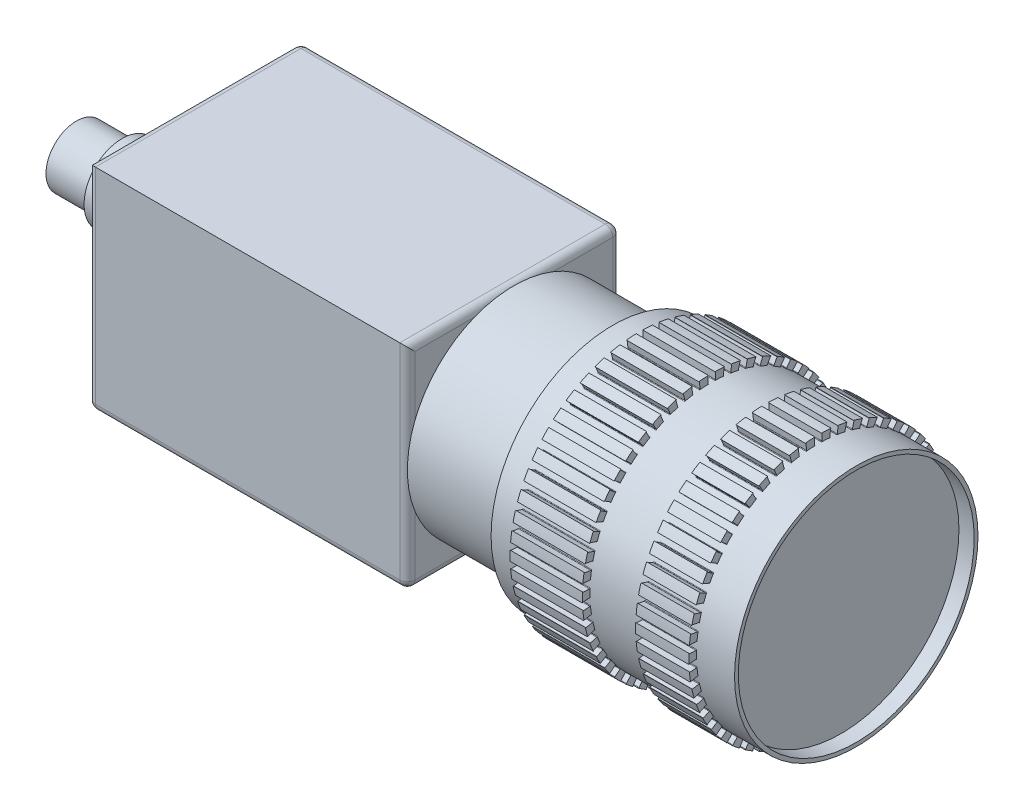
from build123d import *
from build123d.topology import SkipClean

# Parameters (mm, degrees)
SKETCH1_W            = 42
SKETCH1_H            = 28
BOSS_EXTRUDE1_DEPTH  = 28
FILLET1_R            = 1
SKETCH2_R            = 14
BOSS_EXTRUDE2_DEPTH  = 13
SKETCH3_R            = 16
BOSS_EXTRUDE3_DEPTH  = 3.5
SKETCH4_R            = 17
BOSS_EXTRUDE4_DEPTH  = 9.5
CUT_EXTRUDE1_DEPTH   = 9.5
BOSS_EXTRUDE5_START  = 7
SKETCH6_R            = 16
BOSS_EXTRUDE5_DEPTH  = 7
SKETCH7_R            = 17
BOSS_EXTRUDE6_DEPTH  = 7
CUT_EXTRUDE2_DEPTH   = 7
BOSS_EXTRUDE7_START  = 5
SKETCH9_R            = 16
BOSS_EXTRUDE7_DEPTH  = 5
SKETCH11_R           = 5
BOSS_EXTRUDE8_DEPTH  = 1.5
SKETCH12_R           = 4
BOSS_EXTRUDE9_DEPTH  = 6
SKETCH13_R           = 3.4
CUT_EXTRUDE3_DEPTH   = 7
SKETCH14_R           = 0.3
BOSS_EXTRUDE10_DEPTH = 6
CUT_EXTRUDE4_DEPTH   = 1
CUT_EXTRUDE5_DEPTH   = 7
SKETCH17_R           = 15.5
CUT_EXTRUDE6_DEPTH   = 2


with BuildPart() as part:
    # Sketch1 → Boss-Extrude1 (new body)
    with BuildSketch(Plane(origin=(0, 0, 0), x_dir=(1, 0, 0), z_dir=(0, 1, 0))):
        Rectangle(SKETCH1_W, SKETCH1_H)
    extrude(amount=BOSS_EXTRUDE1_DEPTH)

    # Fillet1
    fillet1_edges = [part.edges().sort_by_distance(p)[0] for p in [
        (21, 14, 14),
        (21, 28, 0),
        (-21, 28, 0),
        (-21, 14, 14),
        (0, 0, 14),
        (21, 0, 0),
        (-21, 0, 0),
        (21, 14, -14),
        (0, 28, -14),
        (-21, 14, -14),
        (0, 0, -14),
    ]]
    fillet(fillet1_edges, radius=FILLET1_R)

    # Sketch2 → Boss-Extrude2 (add)
    with BuildSketch(Plane(origin=(21, 0, 0), x_dir=(0, 0, -1), z_dir=(1, 0, 0))):
        with Locations((0, 14)):
            Circle(SKETCH2_R)
    extrude(amount=BOSS_EXTRUDE2_DEPTH)

    # Sketch3 → Boss-Extrude3 (add)
    with BuildSketch(Plane(origin=(34, 0, 0), x_dir=(0, 0, -1), z_dir=(1, 0, 0))):
        with Locations((0, 14)):
            Circle(SKETCH3_R)
    extrude(amount=BOSS_EXTRUDE3_DEPTH)

    # Sketch4 → Boss-Extrude4 (add)
    with BuildSketch(Plane(origin=(37.5, 0, 0), x_dir=(0, 0, -1), z_dir=(1, 0, 0))):
        with Locations((0, 14)):
            Circle(SKETCH4_R)
    extrude(amount=BOSS_EXTRUDE4_DEPTH)

    # Sketch5 → Cut-Extrude1 (cut)
    with SkipClean():  # the faces are left unmerged after this step: merging them gives an invalid solid
        with BuildSketch(Plane(origin=(47, 0, 0), x_dir=(0, 0, -1), z_dir=(1, 0, 0))):
            with BuildLine():
                Line((-0.5, 30.919663117), (-0.5, 30.069380822))
                ThreePointArc((-0.5, 30.069380822), (-0.477327254, 30.015651328), (-0.423017107, 29.994407039))
                ThreePointArc((-0.423017107, 29.994407039), (0, 30), (0.423017107, 29.994407039))
                ThreePointArc((0.423017107, 29.994407039), (0.477327254, 30.015651328), (0.5, 30.069380822))
                Line((0.5, 30.069380822), (0.5, 30.919663117))
                ThreePointArc((0.5, 30.919663117), (0.47869473, 30.972026042), (0.426883309, 30.994639468))
                ThreePointArc((0.426883309, 30.994639468), (0, 31), (-0.426883309, 30.994639468))
                ThreePointArc((-0.426883309, 30.994639468), (-0.47869473, 30.972026042), (-0.5, 30.919663117))
            make_face()
            with BuildLine():
                Line((1.624538739, 30.848913137), (1.517970109, 30.005335571))
                ThreePointArc((1.517970109, 30.005335571), (1.533729982, 29.949188102), (1.584949262, 29.921304464))
                ThreePointArc((1.584949262, 29.921304464), (2.005331737, 29.873835221), (2.424312244, 29.81526826))
                ThreePointArc((2.424312244, 29.81526826), (2.480856755, 29.829538166), (2.51008481, 29.880002338))
                Line((2.51008481, 29.880002338), (2.61665344, 30.723579903))
                ThreePointArc((2.61665344, 30.723579903), (2.602078984, 30.778200189), (2.553510324, 30.807128994))
                ThreePointArc((2.553510324, 30.807128994), (2.130664971, 30.865949922), (1.706475911, 30.914134325))
                ThreePointArc((1.706475911, 30.914134325), (1.652238825, 30.898192906), (1.624538739, 30.848913137))
            make_face()
            with BuildLine():
                Line((3.723457531, 30.512445731), (3.512000923, 29.688876617))
                ThreePointArc((3.512000923, 29.688876617), (3.520599381, 29.631196652), (3.567920035, 29.597113407))
                ThreePointArc((3.567920035, 29.597113407), (3.979038195, 29.497330578), (4.387374529, 29.386713253))
                ThreePointArc((4.387374529, 29.386713253), (4.445261662, 29.39378373), (4.480584084, 29.44018673))
                Line((4.480584084, 29.44018673), (4.692040692, 30.263755844))
                ThreePointArc((4.692040692, 30.263755844), (4.684426897, 30.319772096), (4.639866956, 30.354560056))
                ThreePointArc((4.639866956, 30.354560056), (4.227728082, 30.465913739), (3.812922987, 30.56688318))
                ThreePointArc((3.812922987, 30.56688318), (3.757115586, 30.557865173), (3.723457531, 30.512445731))
            make_face()
            with BuildLine():
                Line((5.763655174, 29.915567192), (5.450645384, 29.124994707))
                ThreePointArc((5.450645384, 29.124994707), (5.451946824, 29.066691893), (5.494622577, 29.026946554))
                ThreePointArc((5.494622577, 29.026946554), (5.889992843, 28.876423774), (6.281245296, 28.715500587))
                ThreePointArc((6.281245296, 28.715500587), (6.339562138, 28.715260129), (6.38042187, 28.756870155))
                Line((6.38042187, 28.756870155), (6.69343166, 29.547442639))
                ThreePointArc((6.69343166, 29.547442639), (6.692898599, 29.603971448), (6.653050115, 29.644069936))
                ThreePointArc((6.653050115, 29.644069936), (6.258117396, 29.80620026), (5.859237989, 29.95836239))
                ThreePointArc((5.859237989, 29.95836239), (5.802740391, 29.956410016), (5.763655174, 29.915567192))
            make_face()
            with BuildLine():
                Line((7.712956531, 29.067690651), (7.303329911, 28.322582595))
                ThreePointArc((7.303329911, 28.322582595), (7.297313809, 28.264576403), (7.334671639, 28.219795777))
                ThreePointArc((7.334671639, 28.219795777), (7.708058786, 28.020906881), (8.076057073, 27.812215686))
                ThreePointArc((8.076057073, 27.812215686), (8.133883932, 27.804668086), (8.179636592, 27.840828921))
                Line((8.179636592, 27.840828921), (8.589263211, 28.585936977))
                ThreePointArc((8.589263211, 28.585936977), (8.595819293, 28.64208685), (8.561310699, 28.686863488))
                ThreePointArc((8.561310699, 28.686863488), (8.18981246, 28.897213561), (7.813149309, 29.098168693))
                ThreePointArc((7.813149309, 29.098168693), (7.756852513, 29.10331274), (7.712956531, 29.067690651))
            make_face()
            with BuildLine():
                Line((9.540619957, 27.982187627), (9.040836563, 27.2942948))
                ThreePointArc((9.040836563, 27.2942948), (9.027597796, 27.237500021), (9.059048548, 27.188390327))
                ThreePointArc((9.059048548, 27.188390327), (9.404564037, 26.94427191), (9.743504605, 26.691103892))
                ThreePointArc((9.743504605, 26.691103892), (9.799929517, 26.67636818), (9.849853558, 26.706509548))
                Line((9.849853558, 26.706509548), (10.349636951, 27.394402375))
                ThreePointArc((10.349636951, 27.394402375), (10.363178781, 27.449287794), (10.334554299, 27.498036429))
                ThreePointArc((10.334554299, 27.498036429), (9.992349289, 27.753288904), (9.643842596, 27.999867856))
                ThreePointArc((9.643842596, 27.999867856), (9.588634437, 28.0120272), (9.540619957, 27.982187627))
            make_face()
            with BuildLine():
                Line((11.217822106, 26.676177152), (10.635763822, 26.056348034))
                ThreePointArc((10.635763822, 26.056348034), (10.615511173, 26.001660357), (10.640558849, 25.948996082))
                ThreePointArc((10.640558849, 25.948996082), (10.952753695, 25.663498039), (11.25729125, 25.369845809))
                ThreePointArc((11.25729125, 25.369845809), (11.31142436, 25.348154376), (11.364732449, 25.371800928))
                Line((11.364732449, 25.371800928), (11.946790734, 25.991630046))
                ThreePointArc((11.946790734, 25.991630046), (11.96710475, 26.044385436), (11.944815804, 26.096337273))
                ThreePointArc((11.944815804, 26.096337273), (11.637300801, 26.392466666), (11.322446724, 26.68078074))
                ThreePointArc((11.322446724, 26.68078074), (11.269197868, 26.699763621), (11.217822106, 26.676177152))
            make_face()
            with BuildLine():
                Line((12.7181125, 25.170255791), (12.062958732, 24.628265458))
                ThreePointArc((12.062958732, 24.628265458), (12.036011597, 24.576547339), (12.054261182, 24.521159032))
                ThreePointArc((12.054261182, 24.521159032), (12.328211884, 24.198783836), (12.593543686, 23.869278465))
                ThreePointArc((12.593543686, 23.869278465), (12.644531283, 23.840973398), (12.700382721, 23.857752215))
                Line((12.700382721, 23.857752215), (13.35553649, 24.399742548))
                ThreePointArc((13.35553649, 24.399742548), (13.382302327, 24.449535925), (13.366700428, 24.503871651))
                ThreePointArc((13.366700428, 24.503871651), (13.098725127, 24.836207826), (12.822489104, 25.161710136))
                ThreePointArc((12.822489104, 25.161710136), (12.772039317, 25.187217183), (12.7181125, 25.170255791))
            make_face()
            with BuildLine():
                Line((14.017830662, 23.488172823), (13.299913576, 23.032568786))
                ThreePointArc((13.299913576, 23.032568786), (13.266696929, 22.984635851), (13.277860614, 22.927397018))
                ThreePointArc((13.277860614, 22.927397018), (13.509246808, 22.57322872), (13.731188416, 22.213066705))
                ThreePointArc((13.731188416, 22.213066705), (13.778226394, 22.178594391), (13.835740371, 22.18824086))
                Line((13.835740371, 22.18824086), (14.553657457, 22.643844897))
                ThreePointArc((14.553657457, 22.643844897), (14.586453003, 22.68989099), (14.577784202, 22.745753699))
                ThreePointArc((14.577784202, 22.745753699), (14.353574734, 23.109055515), (14.120313171, 23.466612696))
                ThreePointArc((14.120313171, 23.466612696), (14.073458077, 23.498241647), (14.017830662, 23.488172823))
            make_face()
            with BuildLine():
                Line((15.096479261, 21.656455702), (14.327120838, 21.294423108))
                ThreePointArc((14.327120838, 21.294423108), (14.288158525, 21.251031289), (14.292060253, 21.19284462))
                ThreePointArc((14.292060253, 21.19284462), (14.477232839, 20.812468665), (14.652284101, 20.427329976))
                ThreePointArc((14.652284101, 20.427329976), (14.694630645, 20.387234064), (14.75290013, 20.389596056))
                Line((14.75290013, 20.389596056), (15.522258553, 20.751628649))
                ThreePointArc((15.522258553, 20.751628649), (15.560566601, 20.793201283), (15.55896761, 20.849709987))
                ThreePointArc((15.55896761, 20.849709987), (15.382059892, 21.238247957), (15.195451465, 21.622221119))
                ThreePointArc((15.195451465, 21.622221119), (15.152929995, 21.659473167), (15.096479261, 21.656455702))
            make_face()
            with BuildLine():
                Line((15.937047364, 19.7039917), (15.128380846, 19.441240021))
                ThreePointArc((15.128380846, 19.441240021), (15.084287325, 19.403073632), (15.080865564, 19.344856766))
                ThreePointArc((15.080865564, 19.344856766), (15.216904261, 18.94427191), (15.342304514, 18.540230414))
                ThreePointArc((15.342304514, 18.540230414), (15.379291792, 18.495143241), (15.437397841, 18.490183505))
                Line((15.437397841, 18.490183505), (16.246064358, 18.752935184))
                ThreePointArc((16.246064358, 18.752935184), (16.289280769, 18.789378733), (16.294776805, 18.845642256))
                ThreePointArc((16.294776805, 18.845642256), (16.167960777, 19.253288904), (16.030948411, 19.657622561))
                ThreePointArc((16.030948411, 19.657622561), (15.993431155, 19.699910219), (15.937047364, 19.7039917))
            make_face()
            with BuildLine():
                Line((16.526278709, 17.661572343), (15.691057251, 17.502245328))
                ThreePointArc((15.691057251, 17.502245328), (15.642527904, 17.469906276), (15.631836616, 17.412577328))
                ThreePointArc((15.631836616, 17.412577328), (15.716596012, 16.998101033), (15.790367619, 16.581528706))
                ThreePointArc((15.790367619, 16.581528706), (15.82141232, 16.532161324), (15.878438566, 16.519958078))
                Line((15.878438566, 16.519958078), (16.713660024, 16.679285092))
                ThreePointArc((16.713660024, 16.679285092), (16.761103248, 16.71002482), (16.773607636, 16.765155853))
                ThreePointArc((16.773607636, 16.765155853), (16.698883262, 17.185482348), (16.613627724, 17.603799916))
                ThreePointArc((16.613627724, 17.603799916), (16.581706353, 17.650456282), (16.526278709, 17.661572343))
            make_face()
            with BuildLine():
                Line((16.854880767, 15.561407802), (16.00627631, 15.508018135))
                ThreePointArc((16.00627631, 15.508018135), (15.954076473, 15.482016425), (15.936284266, 15.426479507))
                ThreePointArc((15.936284266, 15.426479507), (15.968427655, 15.004648312), (15.989407194, 14.582114748))
                ThreePointArc((15.989407194, 14.582114748), (16.014019725, 14.52924571), (16.069066829, 14.509991406))
                Line((16.069066829, 14.509991406), (16.917671287, 14.563381073))
                ThreePointArc((16.917671287, 14.563381073), (16.968593117, 14.587932197), (16.987908654, 14.641061289))
                ThreePointArc((16.987908654, 14.641061289), (16.966454383, 15.067438832), (16.934300204, 15.493143193))
                ThreePointArc((16.934300204, 15.493143193), (16.908478135, 15.543432468), (16.854880767, 15.561407802))
            make_face()
            with BuildLine():
                Line((16.917671287, 13.436618927), (16.069066829, 13.490008594))
                ThreePointArc((16.069066829, 13.490008594), (16.014019725, 13.47075429), (15.989407194, 13.417885252))
                ThreePointArc((15.989407194, 13.417885252), (15.968427655, 12.995351688), (15.936284266, 12.573520493))
                ThreePointArc((15.936284266, 12.573520493), (15.954076473, 12.517983575), (16.00627631, 12.491981865))
                Line((16.00627631, 12.491981865), (16.854880767, 12.438592198))
                ThreePointArc((16.854880767, 12.438592198), (16.908478135, 12.456567532), (16.934300204, 12.506856807))
                ThreePointArc((16.934300204, 12.506856807), (16.966454383, 12.932561168), (16.987908654, 13.358938711))
                ThreePointArc((16.987908654, 13.358938711), (16.968593117, 13.412067803), (16.917671287, 13.436618927))
            make_face()
            with BuildLine():
                Line((16.713660024, 11.320714908), (15.878438566, 11.480041922))
                ThreePointArc((15.878438566, 11.480041922), (15.82141232, 11.467838676), (15.790367619, 11.418471294))
                ThreePointArc((15.790367619, 11.418471294), (15.716596012, 11.001898967), (15.631836616, 10.587422672))
                ThreePointArc((15.631836616, 10.587422672), (15.642527904, 10.530093724), (15.691057251, 10.497754672))
                Line((15.691057251, 10.497754672), (16.526278709, 10.338427657))
                ThreePointArc((16.526278709, 10.338427657), (16.581706353, 10.349543718), (16.613627724, 10.396200084))
                ThreePointArc((16.613627724, 10.396200084), (16.698883262, 10.814517652), (16.773607636, 11.234844147))
                ThreePointArc((16.773607636, 11.234844147), (16.761103248, 11.28997518), (16.713660024, 11.320714908))
            make_face()
            with BuildLine():
                Line((16.246064358, 9.247064816), (15.437397841, 9.509816495))
                ThreePointArc((15.437397841, 9.509816495), (15.379291792, 9.504856759), (15.342304514, 9.459769586))
                ThreePointArc((15.342304514, 9.459769586), (15.216904261, 9.05572809), (15.080865564, 8.655143234))
                ThreePointArc((15.080865564, 8.655143234), (15.084287325, 8.596926368), (15.128380846, 8.558759979))
                Line((15.128380846, 8.558759979), (15.937047364, 8.2960083))
                ThreePointArc((15.937047364, 8.2960083), (15.993431155, 8.300089781), (16.030948411, 8.342377439))
                ThreePointArc((16.030948411, 8.342377439), (16.167960777, 8.746711096), (16.294776805, 9.154357744))
                ThreePointArc((16.294776805, 9.154357744), (16.289280769, 9.210621267), (16.246064358, 9.247064816))
            make_face()
            with BuildLine():
                Line((15.522258553, 7.248371351), (14.75290013, 7.610403944))
                ThreePointArc((14.75290013, 7.610403944), (14.694630645, 7.612765936), (14.652284101, 7.572670024))
                ThreePointArc((14.652284101, 7.572670024), (14.477232839, 7.187531335), (14.292060253, 6.80715538))
                ThreePointArc((14.292060253, 6.80715538), (14.288158525, 6.748968711), (14.327120838, 6.705576892))
                Line((14.327120838, 6.705576892), (15.096479261, 6.343544298))
                ThreePointArc((15.096479261, 6.343544298), (15.152929995, 6.340526833), (15.195451465, 6.377778881))
                ThreePointArc((15.195451465, 6.377778881), (15.382059892, 6.761752043), (15.55896761, 7.150290013))
                ThreePointArc((15.55896761, 7.150290013), (15.560566601, 7.206798717), (15.522258553, 7.248371351))
            make_face()
            with BuildLine():
                Line((14.553657457, 5.356155103), (13.835740371, 5.81175914))
                ThreePointArc((13.835740371, 5.81175914), (13.778226394, 5.821405609), (13.731188416, 5.786933295))
                ThreePointArc((13.731188416, 5.786933295), (13.509246808, 5.42677128), (13.277860614, 5.072602982))
                ThreePointArc((13.277860614, 5.072602982), (13.266696929, 5.015364149), (13.299913576, 4.967431214))
                Line((13.299913576, 4.967431214), (14.017830662, 4.511827177))
                ThreePointArc((14.017830662, 4.511827177), (14.073458077, 4.501758353), (14.120313171, 4.533387304))
                ThreePointArc((14.120313171, 4.533387304), (14.353574734, 4.890944485), (14.577784202, 5.254246301))
                ThreePointArc((14.577784202, 5.254246301), (14.586453003, 5.31010901), (14.553657457, 5.356155103))
            make_face()
            with BuildLine():
                Line((13.35553649, 3.600257452), (12.700382721, 4.142247785))
                ThreePointArc((12.700382721, 4.142247785), (12.644531283, 4.159026602), (12.593543686, 4.130721535))
                ThreePointArc((12.593543686, 4.130721535), (12.328211884, 3.801216164), (12.054261182, 3.478840968))
                ThreePointArc((12.054261182, 3.478840968), (12.036011597, 3.423452661), (12.062958732, 3.371734542))
                Line((12.062958732, 3.371734542), (12.7181125, 2.829744209))
                ThreePointArc((12.7181125, 2.829744209), (12.772039317, 2.812782817), (12.822489104, 2.838289864))
                ThreePointArc((12.822489104, 2.838289864), (13.098725127, 3.163792174), (13.366700428, 3.496128349))
                ThreePointArc((13.366700428, 3.496128349), (13.382302327, 3.550464075), (13.35553649, 3.600257452))
            make_face()
            with BuildLine():
                Line((11.946790734, 2.008369954), (11.364732449, 2.628199072))
                ThreePointArc((11.364732449, 2.628199072), (11.31142436, 2.651845624), (11.25729125, 2.630154191))
                ThreePointArc((11.25729125, 2.630154191), (10.952753695, 2.336501961), (10.640558849, 2.051003918))
                ThreePointArc((10.640558849, 2.051003918), (10.615511173, 1.998339643), (10.635763822, 1.943651966))
                Line((10.635763822, 1.943651966), (11.217822106, 1.323822848))
                ThreePointArc((11.217822106, 1.323822848), (11.269197868, 1.300236379), (11.322446724, 1.31921926))
                ThreePointArc((11.322446724, 1.31921926), (11.637300801, 1.607533334), (11.944815804, 1.903662727))
                ThreePointArc((11.944815804, 1.903662727), (11.96710475, 1.955614564), (11.946790734, 2.008369954))
            make_face()
            with BuildLine():
                Line((10.349636951, 0.605597625), (9.849853558, 1.293490452))
                ThreePointArc((9.849853558, 1.293490452), (9.799929517, 1.32363182), (9.743504605, 1.308896108))
                ThreePointArc((9.743504605, 1.308896108), (9.404564037, 1.05572809), (9.059048548, 0.811609673))
                ThreePointArc((9.059048548, 0.811609673), (9.027597796, 0.762499979), (9.040836563, 0.7057052))
                Line((9.040836563, 0.7057052), (9.540619957, 0.017812373))
                ThreePointArc((9.540619957, 0.017812373), (9.588634437, -0.0120272), (9.643842596, 0.000132144))
                ThreePointArc((9.643842596, 0.000132144), (9.992349289, 0.246711096), (10.334554299, 0.501963571))
                ThreePointArc((10.334554299, 0.501963571), (10.363178781, 0.550712206), (10.349636951, 0.605597625))
            make_face()
            with BuildLine():
                Line((8.589263211, -0.585936977), (8.179636592, 0.159171079))
                ThreePointArc((8.179636592, 0.159171079), (8.133883932, 0.195331914), (8.076057073, 0.187784314))
                ThreePointArc((8.076057073, 0.187784314), (7.708058786, -0.020906881), (7.334671639, -0.219795777))
                ThreePointArc((7.334671639, -0.219795777), (7.297313809, -0.264576403), (7.303329911, -0.322582595))
                Line((7.303329911, -0.322582595), (7.712956531, -1.067690651))
                ThreePointArc((7.712956531, -1.067690651), (7.756852513, -1.10331274), (7.813149309, -1.098168693))
                ThreePointArc((7.813149309, -1.098168693), (8.18981246, -0.897213561), (8.561310699, -0.686863488))
                ThreePointArc((8.561310699, -0.686863488), (8.595819293, -0.64208685), (8.589263211, -0.585936977))
            make_face()
            with BuildLine():
                Line((6.69343166, -1.547442639), (6.38042187, -0.756870155))
                ThreePointArc((6.38042187, -0.756870155), (6.339562138, -0.715260129), (6.281245296, -0.715500587))
                ThreePointArc((6.281245296, -0.715500587), (5.889992843, -0.876423774), (5.494622577, -1.026946554))
                ThreePointArc((5.494622577, -1.026946554), (5.451946824, -1.066691893), (5.450645384, -1.124994707))
                Line((5.450645384, -1.124994707), (5.763655174, -1.915567192))
                ThreePointArc((5.763655174, -1.915567192), (5.802740391, -1.956410016), (5.859237989, -1.95836239))
                ThreePointArc((5.859237989, -1.95836239), (6.258117396, -1.80620026), (6.653050115, -1.644069936))
                ThreePointArc((6.653050115, -1.644069936), (6.692898599, -1.603971448), (6.69343166, -1.547442639))
            make_face()
            with BuildLine():
                Line((4.692040692, -2.263755844), (4.480584084, -1.44018673))
                ThreePointArc((4.480584084, -1.44018673), (4.445261662, -1.39378373), (4.387374529, -1.386713253))
                ThreePointArc((4.387374529, -1.386713253), (3.979038195, -1.497330578), (3.567920035, -1.597113407))
                ThreePointArc((3.567920035, -1.597113407), (3.520599381, -1.631196652), (3.512000923, -1.688876617))
                Line((3.512000923, -1.688876617), (3.723457531, -2.512445731))
                ThreePointArc((3.723457531, -2.512445731), (3.757115586, -2.557865173), (3.812922987, -2.56688318))
                ThreePointArc((3.812922987, -2.56688318), (4.227728082, -2.465913739), (4.639866956, -2.354560056))
                ThreePointArc((4.639866956, -2.354560056), (4.684426897, -2.319772096), (4.692040692, -2.263755844))
            make_face()
            with BuildLine():
                Line((2.61665344, -2.723579903), (2.51008481, -1.880002338))
                ThreePointArc((2.51008481, -1.880002338), (2.480856755, -1.829538166), (2.424312244, -1.81526826))
                ThreePointArc((2.424312244, -1.81526826), (2.005331737, -1.873835221), (1.584949262, -1.921304464))
                ThreePointArc((1.584949262, -1.921304464), (1.533729982, -1.949188102), (1.517970109, -2.005335571))
                Line((1.517970109, -2.005335571), (1.624538739, -2.848913137))
                ThreePointArc((1.624538739, -2.848913137), (1.652238825, -2.898192906), (1.706475911, -2.914134325))
                ThreePointArc((1.706475911, -2.914134325), (2.130664971, -2.865949922), (2.553510324, -2.807128994))
                ThreePointArc((2.553510324, -2.807128994), (2.602078984, -2.778200189), (2.61665344, -2.723579903))
            make_face()
            with BuildLine():
                Line((0.5, -2.919663117), (0.5, -2.069380822))
                ThreePointArc((0.5, -2.069380822), (0.477327254, -2.015651328), (0.423017107, -1.994407039))
                ThreePointArc((0.423017107, -1.994407039), (0, -2), (-0.423017107, -1.994407039))
                ThreePointArc((-0.423017107, -1.994407039), (-0.477327254, -2.015651328), (-0.5, -2.069380822))
                Line((-0.5, -2.069380822), (-0.5, -2.919663117))
                ThreePointArc((-0.5, -2.919663117), (-0.47869473, -2.972026042), (-0.426883309, -2.994639468))
                ThreePointArc((-0.426883309, -2.994639468), (0, -3), (0.426883309, -2.994639468))
                ThreePointArc((0.426883309, -2.994639468), (0.47869473, -2.972026042), (0.5, -2.919663117))
            make_face()
            with BuildLine():
                Line((-1.624538739, -2.848913137), (-1.517970109, -2.005335571))
                ThreePointArc((-1.517970109, -2.005335571), (-1.533729982, -1.949188102), (-1.584949262, -1.921304464))
                ThreePointArc((-1.584949262, -1.921304464), (-2.005331737, -1.873835221), (-2.424312244, -1.81526826))
                ThreePointArc((-2.424312244, -1.81526826), (-2.480856755, -1.829538166), (-2.51008481, -1.880002338))
                Line((-2.51008481, -1.880002338), (-2.61665344, -2.723579903))
                ThreePointArc((-2.61665344, -2.723579903), (-2.602078984, -2.778200189), (-2.553510324, -2.807128994))
                ThreePointArc((-2.553510324, -2.807128994), (-2.130664971, -2.865949922), (-1.706475911, -2.914134325))
                ThreePointArc((-1.706475911, -2.914134325), (-1.652238825, -2.898192906), (-1.624538739, -2.848913137))
            make_face()
            with BuildLine():
                Line((-3.723457531, -2.512445731), (-3.512000923, -1.688876617))
                ThreePointArc((-3.512000923, -1.688876617), (-3.520599381, -1.631196652), (-3.567920035, -1.597113407))
                ThreePointArc((-3.567920035, -1.597113407), (-3.979038195, -1.497330578), (-4.387374529, -1.386713253))
                ThreePointArc((-4.387374529, -1.386713253), (-4.445261662, -1.39378373), (-4.480584084, -1.44018673))
                Line((-4.480584084, -1.44018673), (-4.692040692, -2.263755844))
                ThreePointArc((-4.692040692, -2.263755844), (-4.684426897, -2.319772096), (-4.639866956, -2.354560056))
                ThreePointArc((-4.639866956, -2.354560056), (-4.227728082, -2.465913739), (-3.812922987, -2.56688318))
                ThreePointArc((-3.812922987, -2.56688318), (-3.757115586, -2.557865173), (-3.723457531, -2.512445731))
            make_face()
            with BuildLine():
                Line((-5.763655174, -1.915567192), (-5.450645384, -1.124994707))
                ThreePointArc((-5.450645384, -1.124994707), (-5.451946824, -1.066691893), (-5.494622577, -1.026946554))
                ThreePointArc((-5.494622577, -1.026946554), (-5.889992843, -0.876423774), (-6.281245296, -0.715500587))
                ThreePointArc((-6.281245296, -0.715500587), (-6.339562138, -0.715260129), (-6.38042187, -0.756870155))
                Line((-6.38042187, -0.756870155), (-6.69343166, -1.547442639))
                ThreePointArc((-6.69343166, -1.547442639), (-6.692898599, -1.603971448), (-6.653050115, -1.644069936))
                ThreePointArc((-6.653050115, -1.644069936), (-6.258117396, -1.80620026), (-5.859237989, -1.95836239))
                ThreePointArc((-5.859237989, -1.95836239), (-5.802740391, -1.956410016), (-5.763655174, -1.915567192))
            make_face()
            with BuildLine():
                Line((-7.712956531, -1.067690651), (-7.303329911, -0.322582595))
                ThreePointArc((-7.303329911, -0.322582595), (-7.297313809, -0.264576403), (-7.334671639, -0.219795777))
                ThreePointArc((-7.334671639, -0.219795777), (-7.708058786, -0.020906881), (-8.076057073, 0.187784314))
                ThreePointArc((-8.076057073, 0.187784314), (-8.133883932, 0.195331914), (-8.179636592, 0.159171079))
                Line((-8.179636592, 0.159171079), (-8.589263211, -0.585936977))
                ThreePointArc((-8.589263211, -0.585936977), (-8.595819293, -0.64208685), (-8.561310699, -0.686863488))
                ThreePointArc((-8.561310699, -0.686863488), (-8.18981246, -0.897213561), (-7.813149309, -1.098168693))
                ThreePointArc((-7.813149309, -1.098168693), (-7.756852513, -1.10331274), (-7.712956531, -1.067690651))
            make_face()
            with BuildLine():
                Line((-9.540619957, 0.017812373), (-9.040836563, 0.7057052))
                ThreePointArc((-9.040836563, 0.7057052), (-9.027597796, 0.762499979), (-9.059048548, 0.811609673))
                ThreePointArc((-9.059048548, 0.811609673), (-9.404564037, 1.05572809), (-9.743504605, 1.308896108))
                ThreePointArc((-9.743504605, 1.308896108), (-9.799929517, 1.32363182), (-9.849853558, 1.293490452))
                Line((-9.849853558, 1.293490452), (-10.349636951, 0.605597625))
                ThreePointArc((-10.349636951, 0.605597625), (-10.363178781, 0.550712206), (-10.334554299, 0.501963571))
                ThreePointArc((-10.334554299, 0.501963571), (-9.992349289, 0.246711096), (-9.643842596, 0.000132144))
                ThreePointArc((-9.643842596, 0.000132144), (-9.588634437, -0.0120272), (-9.540619957, 0.017812373))
            make_face()
            with BuildLine():
                Line((-11.217822106, 1.323822848), (-10.635763822, 1.943651966))
                ThreePointArc((-10.635763822, 1.943651966), (-10.615511173, 1.998339643), (-10.640558849, 2.051003918))
                ThreePointArc((-10.640558849, 2.051003918), (-10.952753695, 2.336501961), (-11.25729125, 2.630154191))
                ThreePointArc((-11.25729125, 2.630154191), (-11.31142436, 2.651845624), (-11.364732449, 2.628199072))
                Line((-11.364732449, 2.628199072), (-11.946790734, 2.008369954))
                ThreePointArc((-11.946790734, 2.008369954), (-11.96710475, 1.955614564), (-11.944815804, 1.903662727))
                ThreePointArc((-11.944815804, 1.903662727), (-11.637300801, 1.607533334), (-11.322446724, 1.31921926))
                ThreePointArc((-11.322446724, 1.31921926), (-11.269197868, 1.300236379), (-11.217822106, 1.323822848))
            make_face()
            with BuildLine():
                Line((-12.7181125, 2.829744209), (-12.062958732, 3.371734542))
                ThreePointArc((-12.062958732, 3.371734542), (-12.036011597, 3.423452661), (-12.054261182, 3.478840968))
                ThreePointArc((-12.054261182, 3.478840968), (-12.328211884, 3.801216164), (-12.593543686, 4.130721535))
                ThreePointArc((-12.593543686, 4.130721535), (-12.644531283, 4.159026602), (-12.700382721, 4.142247785))
                Line((-12.700382721, 4.142247785), (-13.35553649, 3.600257452))
                ThreePointArc((-13.35553649, 3.600257452), (-13.382302327, 3.550464075), (-13.366700428, 3.496128349))
                ThreePointArc((-13.366700428, 3.496128349), (-13.098725127, 3.163792174), (-12.822489104, 2.838289864))
                ThreePointArc((-12.822489104, 2.838289864), (-12.772039317, 2.812782817), (-12.7181125, 2.829744209))
            make_face()
            with BuildLine():
                Line((-14.017830662, 4.511827177), (-13.299913576, 4.967431214))
                ThreePointArc((-13.299913576, 4.967431214), (-13.266696929, 5.015364149), (-13.277860614, 5.072602982))
                ThreePointArc((-13.277860614, 5.072602982), (-13.509246808, 5.42677128), (-13.731188416, 5.786933295))
                ThreePointArc((-13.731188416, 5.786933295), (-13.778226394, 5.821405609), (-13.835740371, 5.81175914))
                Line((-13.835740371, 5.81175914), (-14.553657457, 5.356155103))
                ThreePointArc((-14.553657457, 5.356155103), (-14.586453003, 5.31010901), (-14.577784202, 5.254246301))
                ThreePointArc((-14.577784202, 5.254246301), (-14.353574734, 4.890944485), (-14.120313171, 4.533387304))
                ThreePointArc((-14.120313171, 4.533387304), (-14.073458077, 4.501758353), (-14.017830662, 4.511827177))
            make_face()
            with BuildLine():
                Line((-15.096479261, 6.343544298), (-14.327120838, 6.705576892))
                ThreePointArc((-14.327120838, 6.705576892), (-14.288158525, 6.748968711), (-14.292060253, 6.80715538))
                ThreePointArc((-14.292060253, 6.80715538), (-14.477232839, 7.187531335), (-14.652284101, 7.572670024))
                ThreePointArc((-14.652284101, 7.572670024), (-14.694630645, 7.612765936), (-14.75290013, 7.610403944))
                Line((-14.75290013, 7.610403944), (-15.522258553, 7.248371351))
                ThreePointArc((-15.522258553, 7.248371351), (-15.560566601, 7.206798717), (-15.55896761, 7.150290013))
                ThreePointArc((-15.55896761, 7.150290013), (-15.382059892, 6.761752043), (-15.195451465, 6.377778881))
                ThreePointArc((-15.195451465, 6.377778881), (-15.152929995, 6.340526833), (-15.096479261, 6.343544298))
            make_face()
            with BuildLine():
                Line((-15.937047364, 8.2960083), (-15.128380846, 8.558759979))
                ThreePointArc((-15.128380846, 8.558759979), (-15.084287325, 8.596926368), (-15.080865564, 8.655143234))
                ThreePointArc((-15.080865564, 8.655143234), (-15.216904261, 9.05572809), (-15.342304514, 9.459769586))
                ThreePointArc((-15.342304514, 9.459769586), (-15.379291792, 9.504856759), (-15.437397841, 9.509816495))
                Line((-15.437397841, 9.509816495), (-16.246064358, 9.247064816))
                ThreePointArc((-16.246064358, 9.247064816), (-16.289280769, 9.210621267), (-16.294776805, 9.154357744))
                ThreePointArc((-16.294776805, 9.154357744), (-16.167960777, 8.746711096), (-16.030948411, 8.342377439))
                ThreePointArc((-16.030948411, 8.342377439), (-15.993431155, 8.300089781), (-15.937047364, 8.2960083))
            make_face()
            with BuildLine():
                Line((-16.526278709, 10.338427657), (-15.691057251, 10.497754672))
                ThreePointArc((-15.691057251, 10.497754672), (-15.642527904, 10.530093724), (-15.631836616, 10.587422672))
                ThreePointArc((-15.631836616, 10.587422672), (-15.716596012, 11.001898967), (-15.790367619, 11.418471294))
                ThreePointArc((-15.790367619, 11.418471294), (-15.82141232, 11.467838676), (-15.878438566, 11.480041922))
                Line((-15.878438566, 11.480041922), (-16.713660024, 11.320714908))
                ThreePointArc((-16.713660024, 11.320714908), (-16.761103248, 11.28997518), (-16.773607636, 11.234844147))
                ThreePointArc((-16.773607636, 11.234844147), (-16.698883262, 10.814517652), (-16.613627724, 10.396200084))
                ThreePointArc((-16.613627724, 10.396200084), (-16.581706353, 10.349543718), (-16.526278709, 10.338427657))
            make_face()
            with BuildLine():
                Line((-16.854880767, 12.438592198), (-16.00627631, 12.491981865))
                ThreePointArc((-16.00627631, 12.491981865), (-15.954076473, 12.517983575), (-15.936284266, 12.573520493))
                ThreePointArc((-15.936284266, 12.573520493), (-15.968427655, 12.995351688), (-15.989407194, 13.417885252))
                ThreePointArc((-15.989407194, 13.417885252), (-16.014019725, 13.47075429), (-16.069066829, 13.490008594))
                Line((-16.069066829, 13.490008594), (-16.917671287, 13.436618927))
                ThreePointArc((-16.917671287, 13.436618927), (-16.968593117, 13.412067803), (-16.987908654, 13.358938711))
                ThreePointArc((-16.987908654, 13.358938711), (-16.966454383, 12.932561168), (-16.934300204, 12.506856807))
                ThreePointArc((-16.934300204, 12.506856807), (-16.908478135, 12.456567532), (-16.854880767, 12.438592198))
            make_face()
            with BuildLine():
                Line((-16.917671287, 14.563381073), (-16.069066829, 14.509991406))
                ThreePointArc((-16.069066829, 14.509991406), (-16.014019725, 14.52924571), (-15.989407194, 14.582114748))
                ThreePointArc((-15.989407194, 14.582114748), (-15.968427655, 15.004648312), (-15.936284266, 15.426479507))
                ThreePointArc((-15.936284266, 15.426479507), (-15.954076473, 15.482016425), (-16.00627631, 15.508018135))
                Line((-16.00627631, 15.508018135), (-16.854880767, 15.561407802))
                ThreePointArc((-16.854880767, 15.561407802), (-16.908478135, 15.543432468), (-16.934300204, 15.493143193))
                ThreePointArc((-16.934300204, 15.493143193), (-16.966454383, 15.067438832), (-16.987908654, 14.641061289))
                ThreePointArc((-16.987908654, 14.641061289), (-16.968593117, 14.587932197), (-16.917671287, 14.563381073))
            make_face()
            with BuildLine():
                Line((-16.713660024, 16.679285092), (-15.878438566, 16.519958078))
                ThreePointArc((-15.878438566, 16.519958078), (-15.82141232, 16.532161324), (-15.790367619, 16.581528706))
                ThreePointArc((-15.790367619, 16.581528706), (-15.716596012, 16.998101033), (-15.631836616, 17.412577328))
                ThreePointArc((-15.631836616, 17.412577328), (-15.642527904, 17.469906276), (-15.691057251, 17.502245328))
                Line((-15.691057251, 17.502245328), (-16.526278709, 17.661572343))
                ThreePointArc((-16.526278709, 17.661572343), (-16.581706353, 17.650456282), (-16.613627724, 17.603799916))
                ThreePointArc((-16.613627724, 17.603799916), (-16.698883262, 17.185482348), (-16.773607636, 16.765155853))
                ThreePointArc((-16.773607636, 16.765155853), (-16.761103248, 16.71002482), (-16.713660024, 16.679285092))
            make_face()
            with BuildLine():
                Line((-16.246064358, 18.752935184), (-15.437397841, 18.490183505))
                ThreePointArc((-15.437397841, 18.490183505), (-15.379291792, 18.495143241), (-15.342304514, 18.540230414))
                ThreePointArc((-15.342304514, 18.540230414), (-15.216904261, 18.94427191), (-15.080865564, 19.344856766))
                ThreePointArc((-15.080865564, 19.344856766), (-15.084287325, 19.403073632), (-15.128380846, 19.441240021))
                Line((-15.128380846, 19.441240021), (-15.937047364, 19.7039917))
                ThreePointArc((-15.937047364, 19.7039917), (-15.993431155, 19.699910219), (-16.030948411, 19.657622561))
                ThreePointArc((-16.030948411, 19.657622561), (-16.167960777, 19.253288904), (-16.294776805, 18.845642256))
                ThreePointArc((-16.294776805, 18.845642256), (-16.289280769, 18.789378733), (-16.246064358, 18.752935184))
            make_face()
            with BuildLine():
                Line((-15.522258553, 20.751628649), (-14.75290013, 20.389596056))
                ThreePointArc((-14.75290013, 20.389596056), (-14.694630645, 20.387234064), (-14.652284101, 20.427329976))
                ThreePointArc((-14.652284101, 20.427329976), (-14.477232839, 20.812468665), (-14.292060253, 21.19284462))
                ThreePointArc((-14.292060253, 21.19284462), (-14.288158525, 21.251031289), (-14.327120838, 21.294423108))
                Line((-14.327120838, 21.294423108), (-15.096479261, 21.656455702))
                ThreePointArc((-15.096479261, 21.656455702), (-15.152929995, 21.659473167), (-15.195451465, 21.622221119))
                ThreePointArc((-15.195451465, 21.622221119), (-15.382059892, 21.238247957), (-15.55896761, 20.849709987))
                ThreePointArc((-15.55896761, 20.849709987), (-15.560566601, 20.793201283), (-15.522258553, 20.751628649))
            make_face()
            with BuildLine():
                Line((-14.553657457, 22.643844897), (-13.835740371, 22.18824086))
                ThreePointArc((-13.835740371, 22.18824086), (-13.778226394, 22.178594391), (-13.731188416, 22.213066705))
                ThreePointArc((-13.731188416, 22.213066705), (-13.509246808, 22.57322872), (-13.277860614, 22.927397018))
                ThreePointArc((-13.277860614, 22.927397018), (-13.266696929, 22.984635851), (-13.299913576, 23.032568786))
                Line((-13.299913576, 23.032568786), (-14.017830662, 23.488172823))
                ThreePointArc((-14.017830662, 23.488172823), (-14.073458077, 23.498241647), (-14.120313171, 23.466612696))
                ThreePointArc((-14.120313171, 23.466612696), (-14.353574734, 23.109055515), (-14.577784202, 22.745753699))
                ThreePointArc((-14.577784202, 22.745753699), (-14.586453003, 22.68989099), (-14.553657457, 22.643844897))
            make_face()
            with BuildLine():
                Line((-13.35553649, 24.399742548), (-12.700382721, 23.857752215))
                ThreePointArc((-12.700382721, 23.857752215), (-12.644531283, 23.840973398), (-12.593543686, 23.869278465))
                ThreePointArc((-12.593543686, 23.869278465), (-12.328211884, 24.198783836), (-12.054261182, 24.521159032))
                ThreePointArc((-12.054261182, 24.521159032), (-12.036011597, 24.576547339), (-12.062958732, 24.628265458))
                Line((-12.062958732, 24.628265458), (-12.7181125, 25.170255791))
                ThreePointArc((-12.7181125, 25.170255791), (-12.772039317, 25.187217183), (-12.822489104, 25.161710136))
                ThreePointArc((-12.822489104, 25.161710136), (-13.098725127, 24.836207826), (-13.366700428, 24.503871651))
                ThreePointArc((-13.366700428, 24.503871651), (-13.382302327, 24.449535925), (-13.35553649, 24.399742548))
            make_face()
            with BuildLine():
                Line((-11.946790734, 25.991630046), (-11.364732449, 25.371800928))
                ThreePointArc((-11.364732449, 25.371800928), (-11.31142436, 25.348154376), (-11.25729125, 25.369845809))
                ThreePointArc((-11.25729125, 25.369845809), (-10.952753695, 25.663498039), (-10.640558849, 25.948996082))
                ThreePointArc((-10.640558849, 25.948996082), (-10.615511173, 26.001660357), (-10.635763822, 26.056348034))
                Line((-10.635763822, 26.056348034), (-11.217822106, 26.676177152))
                ThreePointArc((-11.217822106, 26.676177152), (-11.269197868, 26.699763621), (-11.322446724, 26.68078074))
                ThreePointArc((-11.322446724, 26.68078074), (-11.637300801, 26.392466666), (-11.944815804, 26.096337273))
                ThreePointArc((-11.944815804, 26.096337273), (-11.96710475, 26.044385436), (-11.946790734, 25.991630046))
            make_face()
            with BuildLine():
                Line((-10.349636951, 27.394402375), (-9.849853558, 26.706509548))
                ThreePointArc((-9.849853558, 26.706509548), (-9.799929517, 26.67636818), (-9.743504605, 26.691103892))
                ThreePointArc((-9.743504605, 26.691103892), (-9.404564037, 26.94427191), (-9.059048548, 27.188390327))
                ThreePointArc((-9.059048548, 27.188390327), (-9.027597796, 27.237500021), (-9.040836563, 27.2942948))
                Line((-9.040836563, 27.2942948), (-9.540619957, 27.982187627))
                ThreePointArc((-9.540619957, 27.982187627), (-9.588634437, 28.0120272), (-9.643842596, 27.999867856))
                ThreePointArc((-9.643842596, 27.999867856), (-9.992349289, 27.753288904), (-10.334554299, 27.498036429))
                ThreePointArc((-10.334554299, 27.498036429), (-10.363178781, 27.449287794), (-10.349636951, 27.394402375))
            make_face()
            with BuildLine():
                Line((-8.589263211, 28.585936977), (-8.179636592, 27.840828921))
                ThreePointArc((-8.179636592, 27.840828921), (-8.133883932, 27.804668086), (-8.076057073, 27.812215686))
                ThreePointArc((-8.076057073, 27.812215686), (-7.708058786, 28.020906881), (-7.334671639, 28.219795777))
                ThreePointArc((-7.334671639, 28.219795777), (-7.297313809, 28.264576403), (-7.303329911, 28.322582595))
                Line((-7.303329911, 28.322582595), (-7.712956531, 29.067690651))
                ThreePointArc((-7.712956531, 29.067690651), (-7.756852513, 29.10331274), (-7.813149309, 29.098168693))
                ThreePointArc((-7.813149309, 29.098168693), (-8.18981246, 28.897213561), (-8.561310699, 28.686863488))
                ThreePointArc((-8.561310699, 28.686863488), (-8.595819293, 28.64208685), (-8.589263211, 28.585936977))
            make_face()
            with BuildLine():
                Line((-6.69343166, 29.547442639), (-6.38042187, 28.756870155))
                ThreePointArc((-6.38042187, 28.756870155), (-6.339562138, 28.715260129), (-6.281245296, 28.715500587))
                ThreePointArc((-6.281245296, 28.715500587), (-5.889992843, 28.876423774), (-5.494622577, 29.026946554))
                ThreePointArc((-5.494622577, 29.026946554), (-5.451946824, 29.066691893), (-5.450645384, 29.124994707))
                Line((-5.450645384, 29.124994707), (-5.763655174, 29.915567192))
                ThreePointArc((-5.763655174, 29.915567192), (-5.802740391, 29.956410016), (-5.859237989, 29.95836239))
                ThreePointArc((-5.859237989, 29.95836239), (-6.258117396, 29.80620026), (-6.653050115, 29.644069936))
                ThreePointArc((-6.653050115, 29.644069936), (-6.692898599, 29.603971448), (-6.69343166, 29.547442639))
            make_face()
            with BuildLine():
                Line((-4.692040692, 30.263755844), (-4.480584084, 29.44018673))
                ThreePointArc((-4.480584084, 29.44018673), (-4.445261662, 29.39378373), (-4.387374529, 29.386713253))
                ThreePointArc((-4.387374529, 29.386713253), (-3.979038195, 29.497330578), (-3.567920035, 29.597113407))
                ThreePointArc((-3.567920035, 29.597113407), (-3.520599381, 29.631196652), (-3.512000923, 29.688876617))
                Line((-3.512000923, 29.688876617), (-3.723457531, 30.512445731))
                ThreePointArc((-3.723457531, 30.512445731), (-3.757115586, 30.557865173), (-3.812922987, 30.56688318))
                ThreePointArc((-3.812922987, 30.56688318), (-4.227728082, 30.465913739), (-4.639866956, 30.354560056))
                ThreePointArc((-4.639866956, 30.354560056), (-4.684426897, 30.319772096), (-4.692040692, 30.263755844))
            make_face()
            with BuildLine():
                Line((-2.61665344, 30.723579903), (-2.51008481, 29.880002338))
                ThreePointArc((-2.51008481, 29.880002338), (-2.480856755, 29.829538166), (-2.424312244, 29.81526826))
                ThreePointArc((-2.424312244, 29.81526826), (-2.005331737, 29.873835221), (-1.584949262, 29.921304464))
                ThreePointArc((-1.584949262, 29.921304464), (-1.533729982, 29.949188102), (-1.517970109, 30.005335571))
                Line((-1.517970109, 30.005335571), (-1.624538739, 30.848913137))
                ThreePointArc((-1.624538739, 30.848913137), (-1.652238825, 30.898192906), (-1.706475911, 30.914134325))
                ThreePointArc((-1.706475911, 30.914134325), (-2.130664971, 30.865949922), (-2.553510324, 30.807128994))
                ThreePointArc((-2.553510324, 30.807128994), (-2.602078984, 30.778200189), (-2.61665344, 30.723579903))
            make_face()
        extrude(amount=-CUT_EXTRUDE1_DEPTH, mode=Mode.SUBTRACT)

    # Sketch6 → Boss-Extrude5 (add)
    with SkipClean():  # the faces are left unmerged after this step: merging them gives an invalid solid
        with BuildSketch(Plane(origin=(47, 0, 0), x_dir=(0, 0, -1), z_dir=(1, 0, 0)).offset(BOSS_EXTRUDE5_START)):
            with Locations((0, 14)):
                Circle(SKETCH6_R)
        extrude(amount=-BOSS_EXTRUDE5_DEPTH)

    # Sketch7 → Boss-Extrude6 (add)
    with SkipClean():  # the faces are left unmerged after this step: merging them gives an invalid solid
        with BuildSketch(Plane(origin=(54, 0, 0), x_dir=(0, 0, -1), z_dir=(1, 0, 0))):
            with Locations((0, 14)):
                Circle(SKETCH7_R)
        extrude(amount=BOSS_EXTRUDE6_DEPTH)

    # Sketch8 → Cut-Extrude2 (cut)
    with SkipClean():  # the faces are left unmerged after this step: merging them gives an invalid solid
        with BuildSketch(Plane(origin=(61, 0, 0), x_dir=(0, 0, -1), z_dir=(1, 0, 0))):
            with BuildLine():
                Line((-0.5, 30.919663117), (-0.5, 30.069380822))
                ThreePointArc((-0.5, 30.069380822), (-0.477327254, 30.015651328), (-0.423017107, 29.994407039))
                ThreePointArc((-0.423017107, 29.994407039), (0, 30), (0.423017107, 29.994407039))
                ThreePointArc((0.423017107, 29.994407039), (0.477327254, 30.015651328), (0.5, 30.069380822))
                Line((0.5, 30.069380822), (0.5, 30.919663117))
                ThreePointArc((0.5, 30.919663117), (0.47869473, 30.972026042), (0.426883309, 30.994639468))
                ThreePointArc((0.426883309, 30.994639468), (0, 31), (-0.426883309, 30.994639468))
                ThreePointArc((-0.426883309, 30.994639468), (-0.47869473, 30.972026042), (-0.5, 30.919663117))
            make_face()
            with BuildLine():
                Line((1.624538739, 30.848913137), (1.517970109, 30.005335571))
                ThreePointArc((1.517970109, 30.005335571), (1.533729982, 29.949188102), (1.584949262, 29.921304464))
                ThreePointArc((1.584949262, 29.921304464), (2.005331737, 29.873835221), (2.424312244, 29.81526826))
                ThreePointArc((2.424312244, 29.81526826), (2.480856755, 29.829538166), (2.51008481, 29.880002338))
                Line((2.51008481, 29.880002338), (2.61665344, 30.723579903))
                ThreePointArc((2.61665344, 30.723579903), (2.602078984, 30.778200189), (2.553510324, 30.807128994))
                ThreePointArc((2.553510324, 30.807128994), (2.130664971, 30.865949922), (1.706475911, 30.914134325))
                ThreePointArc((1.706475911, 30.914134325), (1.652238825, 30.898192906), (1.624538739, 30.848913137))
            make_face()
            with BuildLine():
                Line((3.723457531, 30.512445731), (3.512000923, 29.688876617))
                ThreePointArc((3.512000923, 29.688876617), (3.520599381, 29.631196652), (3.567920035, 29.597113407))
                ThreePointArc((3.567920035, 29.597113407), (3.979038195, 29.497330578), (4.387374529, 29.386713253))
                ThreePointArc((4.387374529, 29.386713253), (4.445261662, 29.39378373), (4.480584084, 29.44018673))
                Line((4.480584084, 29.44018673), (4.692040692, 30.263755844))
                ThreePointArc((4.692040692, 30.263755844), (4.684426897, 30.319772096), (4.639866956, 30.354560056))
                ThreePointArc((4.639866956, 30.354560056), (4.227728082, 30.465913739), (3.812922987, 30.56688318))
                ThreePointArc((3.812922987, 30.56688318), (3.757115586, 30.557865173), (3.723457531, 30.512445731))
            make_face()
            with BuildLine():
                Line((5.763655174, 29.915567192), (5.450645384, 29.124994707))
                ThreePointArc((5.450645384, 29.124994707), (5.451946824, 29.066691893), (5.494622577, 29.026946554))
                ThreePointArc((5.494622577, 29.026946554), (5.889992843, 28.876423774), (6.281245296, 28.715500587))
                ThreePointArc((6.281245296, 28.715500587), (6.339562138, 28.715260129), (6.38042187, 28.756870155))
                Line((6.38042187, 28.756870155), (6.69343166, 29.547442639))
                ThreePointArc((6.69343166, 29.547442639), (6.692898599, 29.603971448), (6.653050115, 29.644069936))
                ThreePointArc((6.653050115, 29.644069936), (6.258117396, 29.80620026), (5.859237989, 29.95836239))
                ThreePointArc((5.859237989, 29.95836239), (5.802740391, 29.956410016), (5.763655174, 29.915567192))
            make_face()
            with BuildLine():
                Line((7.712956531, 29.067690651), (7.303329911, 28.322582595))
                ThreePointArc((7.303329911, 28.322582595), (7.297313809, 28.264576403), (7.334671639, 28.219795777))
                ThreePointArc((7.334671639, 28.219795777), (7.708058786, 28.020906881), (8.076057073, 27.812215686))
                ThreePointArc((8.076057073, 27.812215686), (8.133883932, 27.804668086), (8.179636592, 27.840828921))
                Line((8.179636592, 27.840828921), (8.589263211, 28.585936977))
                ThreePointArc((8.589263211, 28.585936977), (8.595819293, 28.64208685), (8.561310699, 28.686863488))
                ThreePointArc((8.561310699, 28.686863488), (8.18981246, 28.897213561), (7.813149309, 29.098168693))
                ThreePointArc((7.813149309, 29.098168693), (7.756852513, 29.10331274), (7.712956531, 29.067690651))
            make_face()
            with BuildLine():
                Line((9.540619957, 27.982187627), (9.040836563, 27.2942948))
                ThreePointArc((9.040836563, 27.2942948), (9.027597796, 27.237500021), (9.059048548, 27.188390327))
                ThreePointArc((9.059048548, 27.188390327), (9.404564037, 26.94427191), (9.743504605, 26.691103892))
                ThreePointArc((9.743504605, 26.691103892), (9.799929517, 26.67636818), (9.849853558, 26.706509548))
                Line((9.849853558, 26.706509548), (10.349636951, 27.394402375))
                ThreePointArc((10.349636951, 27.394402375), (10.363178781, 27.449287794), (10.334554299, 27.498036429))
                ThreePointArc((10.334554299, 27.498036429), (9.992349289, 27.753288904), (9.643842596, 27.999867856))
                ThreePointArc((9.643842596, 27.999867856), (9.588634437, 28.0120272), (9.540619957, 27.982187627))
            make_face()
            with BuildLine():
                Line((11.217822106, 26.676177152), (10.635763822, 26.056348034))
                ThreePointArc((10.635763822, 26.056348034), (10.615511173, 26.001660357), (10.640558849, 25.948996082))
                ThreePointArc((10.640558849, 25.948996082), (10.952753695, 25.663498039), (11.25729125, 25.369845809))
                ThreePointArc((11.25729125, 25.369845809), (11.31142436, 25.348154376), (11.364732449, 25.371800928))
                Line((11.364732449, 25.371800928), (11.946790734, 25.991630046))
                ThreePointArc((11.946790734, 25.991630046), (11.96710475, 26.044385436), (11.944815804, 26.096337273))
                ThreePointArc((11.944815804, 26.096337273), (11.637300801, 26.392466666), (11.322446724, 26.68078074))
                ThreePointArc((11.322446724, 26.68078074), (11.269197868, 26.699763621), (11.217822106, 26.676177152))
            make_face()
            with BuildLine():
                Line((12.7181125, 25.170255791), (12.062958732, 24.628265458))
                ThreePointArc((12.062958732, 24.628265458), (12.036011597, 24.576547339), (12.054261182, 24.521159032))
                ThreePointArc((12.054261182, 24.521159032), (12.328211884, 24.198783836), (12.593543686, 23.869278465))
                ThreePointArc((12.593543686, 23.869278465), (12.644531283, 23.840973398), (12.700382721, 23.857752215))
                Line((12.700382721, 23.857752215), (13.35553649, 24.399742548))
                ThreePointArc((13.35553649, 24.399742548), (13.382302327, 24.449535925), (13.366700428, 24.503871651))
                ThreePointArc((13.366700428, 24.503871651), (13.098725127, 24.836207826), (12.822489104, 25.161710136))
                ThreePointArc((12.822489104, 25.161710136), (12.772039317, 25.187217183), (12.7181125, 25.170255791))
            make_face()
            with BuildLine():
                Line((14.017830662, 23.488172823), (13.299913576, 23.032568786))
                ThreePointArc((13.299913576, 23.032568786), (13.266696929, 22.984635851), (13.277860614, 22.927397018))
                ThreePointArc((13.277860614, 22.927397018), (13.509246808, 22.57322872), (13.731188416, 22.213066705))
                ThreePointArc((13.731188416, 22.213066705), (13.778226394, 22.178594391), (13.835740371, 22.18824086))
                Line((13.835740371, 22.18824086), (14.553657457, 22.643844897))
                ThreePointArc((14.553657457, 22.643844897), (14.586453003, 22.68989099), (14.577784202, 22.745753699))
                ThreePointArc((14.577784202, 22.745753699), (14.353574734, 23.109055515), (14.120313171, 23.466612696))
                ThreePointArc((14.120313171, 23.466612696), (14.073458077, 23.498241647), (14.017830662, 23.488172823))
            make_face()
            with BuildLine():
                Line((15.096479261, 21.656455702), (14.327120838, 21.294423108))
                ThreePointArc((14.327120838, 21.294423108), (14.288158525, 21.251031289), (14.292060253, 21.19284462))
                ThreePointArc((14.292060253, 21.19284462), (14.477232839, 20.812468665), (14.652284101, 20.427329976))
                ThreePointArc((14.652284101, 20.427329976), (14.694630645, 20.387234064), (14.75290013, 20.389596056))
                Line((14.75290013, 20.389596056), (15.522258553, 20.751628649))
                ThreePointArc((15.522258553, 20.751628649), (15.560566601, 20.793201283), (15.55896761, 20.849709987))
                ThreePointArc((15.55896761, 20.849709987), (15.382059892, 21.238247957), (15.195451465, 21.622221119))
                ThreePointArc((15.195451465, 21.622221119), (15.152929995, 21.659473167), (15.096479261, 21.656455702))
            make_face()
            with BuildLine():
                Line((15.937047364, 19.7039917), (15.128380846, 19.441240021))
                ThreePointArc((15.128380846, 19.441240021), (15.084287325, 19.403073632), (15.080865564, 19.344856766))
                ThreePointArc((15.080865564, 19.344856766), (15.216904261, 18.94427191), (15.342304514, 18.540230414))
                ThreePointArc((15.342304514, 18.540230414), (15.379291792, 18.495143241), (15.437397841, 18.490183505))
                Line((15.437397841, 18.490183505), (16.246064358, 18.752935184))
                ThreePointArc((16.246064358, 18.752935184), (16.289280769, 18.789378733), (16.294776805, 18.845642256))
                ThreePointArc((16.294776805, 18.845642256), (16.167960777, 19.253288904), (16.030948411, 19.657622561))
                ThreePointArc((16.030948411, 19.657622561), (15.993431155, 19.699910219), (15.937047364, 19.7039917))
            make_face()
            with BuildLine():
                Line((16.526278709, 17.661572343), (15.691057251, 17.502245328))
                ThreePointArc((15.691057251, 17.502245328), (15.642527904, 17.469906276), (15.631836616, 17.412577328))
                ThreePointArc((15.631836616, 17.412577328), (15.716596012, 16.998101033), (15.790367619, 16.581528706))
                ThreePointArc((15.790367619, 16.581528706), (15.82141232, 16.532161324), (15.878438566, 16.519958078))
                Line((15.878438566, 16.519958078), (16.713660024, 16.679285092))
                ThreePointArc((16.713660024, 16.679285092), (16.761103248, 16.71002482), (16.773607636, 16.765155853))
                ThreePointArc((16.773607636, 16.765155853), (16.698883262, 17.185482348), (16.613627724, 17.603799916))
                ThreePointArc((16.613627724, 17.603799916), (16.581706353, 17.650456282), (16.526278709, 17.661572343))
            make_face()
            with BuildLine():
                Line((16.854880767, 15.561407802), (16.00627631, 15.508018135))
                ThreePointArc((16.00627631, 15.508018135), (15.954076473, 15.482016425), (15.936284266, 15.426479507))
                ThreePointArc((15.936284266, 15.426479507), (15.968427655, 15.004648312), (15.989407194, 14.582114748))
                ThreePointArc((15.989407194, 14.582114748), (16.014019725, 14.52924571), (16.069066829, 14.509991406))
                Line((16.069066829, 14.509991406), (16.917671287, 14.563381073))
                ThreePointArc((16.917671287, 14.563381073), (16.968593117, 14.587932197), (16.987908654, 14.641061289))
                ThreePointArc((16.987908654, 14.641061289), (16.966454383, 15.067438832), (16.934300204, 15.493143193))
                ThreePointArc((16.934300204, 15.493143193), (16.908478135, 15.543432468), (16.854880767, 15.561407802))
            make_face()
            with BuildLine():
                Line((16.917671287, 13.436618927), (16.069066829, 13.490008594))
                ThreePointArc((16.069066829, 13.490008594), (16.014019725, 13.47075429), (15.989407194, 13.417885252))
                ThreePointArc((15.989407194, 13.417885252), (15.968427655, 12.995351688), (15.936284266, 12.573520493))
                ThreePointArc((15.936284266, 12.573520493), (15.954076473, 12.517983575), (16.00627631, 12.491981865))
                Line((16.00627631, 12.491981865), (16.854880767, 12.438592198))
                ThreePointArc((16.854880767, 12.438592198), (16.908478135, 12.456567532), (16.934300204, 12.506856807))
                ThreePointArc((16.934300204, 12.506856807), (16.966454383, 12.932561168), (16.987908654, 13.358938711))
                ThreePointArc((16.987908654, 13.358938711), (16.968593117, 13.412067803), (16.917671287, 13.436618927))
            make_face()
            with BuildLine():
                Line((16.713660024, 11.320714908), (15.878438566, 11.480041922))
                ThreePointArc((15.878438566, 11.480041922), (15.82141232, 11.467838676), (15.790367619, 11.418471294))
                ThreePointArc((15.790367619, 11.418471294), (15.716596012, 11.001898967), (15.631836616, 10.587422672))
                ThreePointArc((15.631836616, 10.587422672), (15.642527904, 10.530093724), (15.691057251, 10.497754672))
                Line((15.691057251, 10.497754672), (16.526278709, 10.338427657))
                ThreePointArc((16.526278709, 10.338427657), (16.581706353, 10.349543718), (16.613627724, 10.396200084))
                ThreePointArc((16.613627724, 10.396200084), (16.698883262, 10.814517652), (16.773607636, 11.234844147))
                ThreePointArc((16.773607636, 11.234844147), (16.761103248, 11.28997518), (16.713660024, 11.320714908))
            make_face()
            with BuildLine():
                Line((16.246064358, 9.247064816), (15.437397841, 9.509816495))
                ThreePointArc((15.437397841, 9.509816495), (15.379291792, 9.504856759), (15.342304514, 9.459769586))
                ThreePointArc((15.342304514, 9.459769586), (15.216904261, 9.05572809), (15.080865564, 8.655143234))
                ThreePointArc((15.080865564, 8.655143234), (15.084287325, 8.596926368), (15.128380846, 8.558759979))
                Line((15.128380846, 8.558759979), (15.937047364, 8.2960083))
                ThreePointArc((15.937047364, 8.2960083), (15.993431155, 8.300089781), (16.030948411, 8.342377439))
                ThreePointArc((16.030948411, 8.342377439), (16.167960777, 8.746711096), (16.294776805, 9.154357744))
                ThreePointArc((16.294776805, 9.154357744), (16.289280769, 9.210621267), (16.246064358, 9.247064816))
            make_face()
            with BuildLine():
                Line((15.522258553, 7.248371351), (14.75290013, 7.610403944))
                ThreePointArc((14.75290013, 7.610403944), (14.694630645, 7.612765936), (14.652284101, 7.572670024))
                ThreePointArc((14.652284101, 7.572670024), (14.477232839, 7.187531335), (14.292060253, 6.80715538))
                ThreePointArc((14.292060253, 6.80715538), (14.288158525, 6.748968711), (14.327120838, 6.705576892))
                Line((14.327120838, 6.705576892), (15.096479261, 6.343544298))
                ThreePointArc((15.096479261, 6.343544298), (15.152929995, 6.340526833), (15.195451465, 6.377778881))
                ThreePointArc((15.195451465, 6.377778881), (15.382059892, 6.761752043), (15.55896761, 7.150290013))
                ThreePointArc((15.55896761, 7.150290013), (15.560566601, 7.206798717), (15.522258553, 7.248371351))
            make_face()
            with BuildLine():
                Line((14.553657457, 5.356155103), (13.835740371, 5.81175914))
                ThreePointArc((13.835740371, 5.81175914), (13.778226394, 5.821405609), (13.731188416, 5.786933295))
                ThreePointArc((13.731188416, 5.786933295), (13.509246808, 5.42677128), (13.277860614, 5.072602982))
                ThreePointArc((13.277860614, 5.072602982), (13.266696929, 5.015364149), (13.299913576, 4.967431214))
                Line((13.299913576, 4.967431214), (14.017830662, 4.511827177))
                ThreePointArc((14.017830662, 4.511827177), (14.073458077, 4.501758353), (14.120313171, 4.533387304))
                ThreePointArc((14.120313171, 4.533387304), (14.353574734, 4.890944485), (14.577784202, 5.254246301))
                ThreePointArc((14.577784202, 5.254246301), (14.586453003, 5.31010901), (14.553657457, 5.356155103))
            make_face()
            with BuildLine():
                Line((13.35553649, 3.600257452), (12.700382721, 4.142247785))
                ThreePointArc((12.700382721, 4.142247785), (12.644531283, 4.159026602), (12.593543686, 4.130721535))
                ThreePointArc((12.593543686, 4.130721535), (12.328211884, 3.801216164), (12.054261182, 3.478840968))
                ThreePointArc((12.054261182, 3.478840968), (12.036011597, 3.423452661), (12.062958732, 3.371734542))
                Line((12.062958732, 3.371734542), (12.7181125, 2.829744209))
                ThreePointArc((12.7181125, 2.829744209), (12.772039317, 2.812782817), (12.822489104, 2.838289864))
                ThreePointArc((12.822489104, 2.838289864), (13.098725127, 3.163792174), (13.366700428, 3.496128349))
                ThreePointArc((13.366700428, 3.496128349), (13.382302327, 3.550464075), (13.35553649, 3.600257452))
            make_face()
            with BuildLine():
                Line((11.946790734, 2.008369954), (11.364732449, 2.628199072))
                ThreePointArc((11.364732449, 2.628199072), (11.31142436, 2.651845624), (11.25729125, 2.630154191))
                ThreePointArc((11.25729125, 2.630154191), (10.952753695, 2.336501961), (10.640558849, 2.051003918))
                ThreePointArc((10.640558849, 2.051003918), (10.615511173, 1.998339643), (10.635763822, 1.943651966))
                Line((10.635763822, 1.943651966), (11.217822106, 1.323822848))
                ThreePointArc((11.217822106, 1.323822848), (11.269197868, 1.300236379), (11.322446724, 1.31921926))
                ThreePointArc((11.322446724, 1.31921926), (11.637300801, 1.607533334), (11.944815804, 1.903662727))
                ThreePointArc((11.944815804, 1.903662727), (11.96710475, 1.955614564), (11.946790734, 2.008369954))
            make_face()
            with BuildLine():
                Line((10.349636951, 0.605597625), (9.849853558, 1.293490452))
                ThreePointArc((9.849853558, 1.293490452), (9.799929517, 1.32363182), (9.743504605, 1.308896108))
                ThreePointArc((9.743504605, 1.308896108), (9.404564037, 1.05572809), (9.059048548, 0.811609673))
                ThreePointArc((9.059048548, 0.811609673), (9.027597796, 0.762499979), (9.040836563, 0.7057052))
                Line((9.040836563, 0.7057052), (9.540619957, 0.017812373))
                ThreePointArc((9.540619957, 0.017812373), (9.588634437, -0.0120272), (9.643842596, 0.000132144))
                ThreePointArc((9.643842596, 0.000132144), (9.992349289, 0.246711096), (10.334554299, 0.501963571))
                ThreePointArc((10.334554299, 0.501963571), (10.363178781, 0.550712206), (10.349636951, 0.605597625))
            make_face()
            with BuildLine():
                Line((8.589263211, -0.585936977), (8.179636592, 0.159171079))
                ThreePointArc((8.179636592, 0.159171079), (8.133883932, 0.195331914), (8.076057073, 0.187784314))
                ThreePointArc((8.076057073, 0.187784314), (7.708058786, -0.020906881), (7.334671639, -0.219795777))
                ThreePointArc((7.334671639, -0.219795777), (7.297313809, -0.264576403), (7.303329911, -0.322582595))
                Line((7.303329911, -0.322582595), (7.712956531, -1.067690651))
                ThreePointArc((7.712956531, -1.067690651), (7.756852513, -1.10331274), (7.813149309, -1.098168693))
                ThreePointArc((7.813149309, -1.098168693), (8.18981246, -0.897213561), (8.561310699, -0.686863488))
                ThreePointArc((8.561310699, -0.686863488), (8.595819293, -0.64208685), (8.589263211, -0.585936977))
            make_face()
            with BuildLine():
                Line((6.69343166, -1.547442639), (6.38042187, -0.756870155))
                ThreePointArc((6.38042187, -0.756870155), (6.339562138, -0.715260129), (6.281245296, -0.715500587))
                ThreePointArc((6.281245296, -0.715500587), (5.889992843, -0.876423774), (5.494622577, -1.026946554))
                ThreePointArc((5.494622577, -1.026946554), (5.451946824, -1.066691893), (5.450645384, -1.124994707))
                Line((5.450645384, -1.124994707), (5.763655174, -1.915567192))
                ThreePointArc((5.763655174, -1.915567192), (5.802740391, -1.956410016), (5.859237989, -1.95836239))
                ThreePointArc((5.859237989, -1.95836239), (6.258117396, -1.80620026), (6.653050115, -1.644069936))
                ThreePointArc((6.653050115, -1.644069936), (6.692898599, -1.603971448), (6.69343166, -1.547442639))
            make_face()
            with BuildLine():
                Line((4.692040692, -2.263755844), (4.480584084, -1.44018673))
                ThreePointArc((4.480584084, -1.44018673), (4.445261662, -1.39378373), (4.387374529, -1.386713253))
                ThreePointArc((4.387374529, -1.386713253), (3.979038195, -1.497330578), (3.567920035, -1.597113407))
                ThreePointArc((3.567920035, -1.597113407), (3.520599381, -1.631196652), (3.512000923, -1.688876617))
                Line((3.512000923, -1.688876617), (3.723457531, -2.512445731))
                ThreePointArc((3.723457531, -2.512445731), (3.757115586, -2.557865173), (3.812922987, -2.56688318))
                ThreePointArc((3.812922987, -2.56688318), (4.227728082, -2.465913739), (4.639866956, -2.354560056))
                ThreePointArc((4.639866956, -2.354560056), (4.684426897, -2.319772096), (4.692040692, -2.263755844))
            make_face()
            with BuildLine():
                Line((2.61665344, -2.723579903), (2.51008481, -1.880002338))
                ThreePointArc((2.51008481, -1.880002338), (2.480856755, -1.829538166), (2.424312244, -1.81526826))
                ThreePointArc((2.424312244, -1.81526826), (2.005331737, -1.873835221), (1.584949262, -1.921304464))
                ThreePointArc((1.584949262, -1.921304464), (1.533729982, -1.949188102), (1.517970109, -2.005335571))
                Line((1.517970109, -2.005335571), (1.624538739, -2.848913137))
                ThreePointArc((1.624538739, -2.848913137), (1.652238825, -2.898192906), (1.706475911, -2.914134325))
                ThreePointArc((1.706475911, -2.914134325), (2.130664971, -2.865949922), (2.553510324, -2.807128994))
                ThreePointArc((2.553510324, -2.807128994), (2.602078984, -2.778200189), (2.61665344, -2.723579903))
            make_face()
            with BuildLine():
                Line((0.5, -2.919663117), (0.5, -2.069380822))
                ThreePointArc((0.5, -2.069380822), (0.477327254, -2.015651328), (0.423017107, -1.994407039))
                ThreePointArc((0.423017107, -1.994407039), (0, -2), (-0.423017107, -1.994407039))
                ThreePointArc((-0.423017107, -1.994407039), (-0.477327254, -2.015651328), (-0.5, -2.069380822))
                Line((-0.5, -2.069380822), (-0.5, -2.919663117))
                ThreePointArc((-0.5, -2.919663117), (-0.47869473, -2.972026042), (-0.426883309, -2.994639468))
                ThreePointArc((-0.426883309, -2.994639468), (0, -3), (0.426883309, -2.994639468))
                ThreePointArc((0.426883309, -2.994639468), (0.47869473, -2.972026042), (0.5, -2.919663117))
            make_face()
            with BuildLine():
                Line((-1.624538739, -2.848913137), (-1.517970109, -2.005335571))
                ThreePointArc((-1.517970109, -2.005335571), (-1.533729982, -1.949188102), (-1.584949262, -1.921304464))
                ThreePointArc((-1.584949262, -1.921304464), (-2.005331737, -1.873835221), (-2.424312244, -1.81526826))
                ThreePointArc((-2.424312244, -1.81526826), (-2.480856755, -1.829538166), (-2.51008481, -1.880002338))
                Line((-2.51008481, -1.880002338), (-2.61665344, -2.723579903))
                ThreePointArc((-2.61665344, -2.723579903), (-2.602078984, -2.778200189), (-2.553510324, -2.807128994))
                ThreePointArc((-2.553510324, -2.807128994), (-2.130664971, -2.865949922), (-1.706475911, -2.914134325))
                ThreePointArc((-1.706475911, -2.914134325), (-1.652238825, -2.898192906), (-1.624538739, -2.848913137))
            make_face()
            with BuildLine():
                Line((-3.723457531, -2.512445731), (-3.512000923, -1.688876617))
                ThreePointArc((-3.512000923, -1.688876617), (-3.520599381, -1.631196652), (-3.567920035, -1.597113407))
                ThreePointArc((-3.567920035, -1.597113407), (-3.979038195, -1.497330578), (-4.387374529, -1.386713253))
                ThreePointArc((-4.387374529, -1.386713253), (-4.445261662, -1.39378373), (-4.480584084, -1.44018673))
                Line((-4.480584084, -1.44018673), (-4.692040692, -2.263755844))
                ThreePointArc((-4.692040692, -2.263755844), (-4.684426897, -2.319772096), (-4.639866956, -2.354560056))
                ThreePointArc((-4.639866956, -2.354560056), (-4.227728082, -2.465913739), (-3.812922987, -2.56688318))
                ThreePointArc((-3.812922987, -2.56688318), (-3.757115586, -2.557865173), (-3.723457531, -2.512445731))
            make_face()
            with BuildLine():
                Line((-5.763655174, -1.915567192), (-5.450645384, -1.124994707))
                ThreePointArc((-5.450645384, -1.124994707), (-5.451946824, -1.066691893), (-5.494622577, -1.026946554))
                ThreePointArc((-5.494622577, -1.026946554), (-5.889992843, -0.876423774), (-6.281245296, -0.715500587))
                ThreePointArc((-6.281245296, -0.715500587), (-6.339562138, -0.715260129), (-6.38042187, -0.756870155))
                Line((-6.38042187, -0.756870155), (-6.69343166, -1.547442639))
                ThreePointArc((-6.69343166, -1.547442639), (-6.692898599, -1.603971448), (-6.653050115, -1.644069936))
                ThreePointArc((-6.653050115, -1.644069936), (-6.258117396, -1.80620026), (-5.859237989, -1.95836239))
                ThreePointArc((-5.859237989, -1.95836239), (-5.802740391, -1.956410016), (-5.763655174, -1.915567192))
            make_face()
            with BuildLine():
                Line((-7.712956531, -1.067690651), (-7.303329911, -0.322582595))
                ThreePointArc((-7.303329911, -0.322582595), (-7.297313809, -0.264576403), (-7.334671639, -0.219795777))
                ThreePointArc((-7.334671639, -0.219795777), (-7.708058786, -0.020906881), (-8.076057073, 0.187784314))
                ThreePointArc((-8.076057073, 0.187784314), (-8.133883932, 0.195331914), (-8.179636592, 0.159171079))
                Line((-8.179636592, 0.159171079), (-8.589263211, -0.585936977))
                ThreePointArc((-8.589263211, -0.585936977), (-8.595819293, -0.64208685), (-8.561310699, -0.686863488))
                ThreePointArc((-8.561310699, -0.686863488), (-8.18981246, -0.897213561), (-7.813149309, -1.098168693))
                ThreePointArc((-7.813149309, -1.098168693), (-7.756852513, -1.10331274), (-7.712956531, -1.067690651))
            make_face()
            with BuildLine():
                Line((-9.540619957, 0.017812373), (-9.040836563, 0.7057052))
                ThreePointArc((-9.040836563, 0.7057052), (-9.027597796, 0.762499979), (-9.059048548, 0.811609673))
                ThreePointArc((-9.059048548, 0.811609673), (-9.404564037, 1.05572809), (-9.743504605, 1.308896108))
                ThreePointArc((-9.743504605, 1.308896108), (-9.799929517, 1.32363182), (-9.849853558, 1.293490452))
                Line((-9.849853558, 1.293490452), (-10.349636951, 0.605597625))
                ThreePointArc((-10.349636951, 0.605597625), (-10.363178781, 0.550712206), (-10.334554299, 0.501963571))
                ThreePointArc((-10.334554299, 0.501963571), (-9.992349289, 0.246711096), (-9.643842596, 0.000132144))
                ThreePointArc((-9.643842596, 0.000132144), (-9.588634437, -0.0120272), (-9.540619957, 0.017812373))
            make_face()
            with BuildLine():
                Line((-11.217822106, 1.323822848), (-10.635763822, 1.943651966))
                ThreePointArc((-10.635763822, 1.943651966), (-10.615511173, 1.998339643), (-10.640558849, 2.051003918))
                ThreePointArc((-10.640558849, 2.051003918), (-10.952753695, 2.336501961), (-11.25729125, 2.630154191))
                ThreePointArc((-11.25729125, 2.630154191), (-11.31142436, 2.651845624), (-11.364732449, 2.628199072))
                Line((-11.364732449, 2.628199072), (-11.946790734, 2.008369954))
                ThreePointArc((-11.946790734, 2.008369954), (-11.96710475, 1.955614564), (-11.944815804, 1.903662727))
                ThreePointArc((-11.944815804, 1.903662727), (-11.637300801, 1.607533334), (-11.322446724, 1.31921926))
                ThreePointArc((-11.322446724, 1.31921926), (-11.269197868, 1.300236379), (-11.217822106, 1.323822848))
            make_face()
            with BuildLine():
                Line((-12.7181125, 2.829744209), (-12.062958732, 3.371734542))
                ThreePointArc((-12.062958732, 3.371734542), (-12.036011597, 3.423452661), (-12.054261182, 3.478840968))
                ThreePointArc((-12.054261182, 3.478840968), (-12.328211884, 3.801216164), (-12.593543686, 4.130721535))
                ThreePointArc((-12.593543686, 4.130721535), (-12.644531283, 4.159026602), (-12.700382721, 4.142247785))
                Line((-12.700382721, 4.142247785), (-13.35553649, 3.600257452))
                ThreePointArc((-13.35553649, 3.600257452), (-13.382302327, 3.550464075), (-13.366700428, 3.496128349))
                ThreePointArc((-13.366700428, 3.496128349), (-13.098725127, 3.163792174), (-12.822489104, 2.838289864))
                ThreePointArc((-12.822489104, 2.838289864), (-12.772039317, 2.812782817), (-12.7181125, 2.829744209))
            make_face()
            with BuildLine():
                Line((-14.017830662, 4.511827177), (-13.299913576, 4.967431214))
                ThreePointArc((-13.299913576, 4.967431214), (-13.266696929, 5.015364149), (-13.277860614, 5.072602982))
                ThreePointArc((-13.277860614, 5.072602982), (-13.509246808, 5.42677128), (-13.731188416, 5.786933295))
                ThreePointArc((-13.731188416, 5.786933295), (-13.778226394, 5.821405609), (-13.835740371, 5.81175914))
                Line((-13.835740371, 5.81175914), (-14.553657457, 5.356155103))
                ThreePointArc((-14.553657457, 5.356155103), (-14.586453003, 5.31010901), (-14.577784202, 5.254246301))
                ThreePointArc((-14.577784202, 5.254246301), (-14.353574734, 4.890944485), (-14.120313171, 4.533387304))
                ThreePointArc((-14.120313171, 4.533387304), (-14.073458077, 4.501758353), (-14.017830662, 4.511827177))
            make_face()
            with BuildLine():
                Line((-15.096479261, 6.343544298), (-14.327120838, 6.705576892))
                ThreePointArc((-14.327120838, 6.705576892), (-14.288158525, 6.748968711), (-14.292060253, 6.80715538))
                ThreePointArc((-14.292060253, 6.80715538), (-14.477232839, 7.187531335), (-14.652284101, 7.572670024))
                ThreePointArc((-14.652284101, 7.572670024), (-14.694630645, 7.612765936), (-14.75290013, 7.610403944))
                Line((-14.75290013, 7.610403944), (-15.522258553, 7.248371351))
                ThreePointArc((-15.522258553, 7.248371351), (-15.560566601, 7.206798717), (-15.55896761, 7.150290013))
                ThreePointArc((-15.55896761, 7.150290013), (-15.382059892, 6.761752043), (-15.195451465, 6.377778881))
                ThreePointArc((-15.195451465, 6.377778881), (-15.152929995, 6.340526833), (-15.096479261, 6.343544298))
            make_face()
            with BuildLine():
                Line((-15.937047364, 8.2960083), (-15.128380846, 8.558759979))
                ThreePointArc((-15.128380846, 8.558759979), (-15.084287325, 8.596926368), (-15.080865564, 8.655143234))
                ThreePointArc((-15.080865564, 8.655143234), (-15.216904261, 9.05572809), (-15.342304514, 9.459769586))
                ThreePointArc((-15.342304514, 9.459769586), (-15.379291792, 9.504856759), (-15.437397841, 9.509816495))
                Line((-15.437397841, 9.509816495), (-16.246064358, 9.247064816))
                ThreePointArc((-16.246064358, 9.247064816), (-16.289280769, 9.210621267), (-16.294776805, 9.154357744))
                ThreePointArc((-16.294776805, 9.154357744), (-16.167960777, 8.746711096), (-16.030948411, 8.342377439))
                ThreePointArc((-16.030948411, 8.342377439), (-15.993431155, 8.300089781), (-15.937047364, 8.2960083))
            make_face()
            with BuildLine():
                Line((-16.526278709, 10.338427657), (-15.691057251, 10.497754672))
                ThreePointArc((-15.691057251, 10.497754672), (-15.642527904, 10.530093724), (-15.631836616, 10.587422672))
                ThreePointArc((-15.631836616, 10.587422672), (-15.716596012, 11.001898967), (-15.790367619, 11.418471294))
                ThreePointArc((-15.790367619, 11.418471294), (-15.82141232, 11.467838676), (-15.878438566, 11.480041922))
                Line((-15.878438566, 11.480041922), (-16.713660024, 11.320714908))
                ThreePointArc((-16.713660024, 11.320714908), (-16.761103248, 11.28997518), (-16.773607636, 11.234844147))
                ThreePointArc((-16.773607636, 11.234844147), (-16.698883262, 10.814517652), (-16.613627724, 10.396200084))
                ThreePointArc((-16.613627724, 10.396200084), (-16.581706353, 10.349543718), (-16.526278709, 10.338427657))
            make_face()
            with BuildLine():
                Line((-16.854880767, 12.438592198), (-16.00627631, 12.491981865))
                ThreePointArc((-16.00627631, 12.491981865), (-15.954076473, 12.517983575), (-15.936284266, 12.573520493))
                ThreePointArc((-15.936284266, 12.573520493), (-15.968427655, 12.995351688), (-15.989407194, 13.417885252))
                ThreePointArc((-15.989407194, 13.417885252), (-16.014019725, 13.47075429), (-16.069066829, 13.490008594))
                Line((-16.069066829, 13.490008594), (-16.917671287, 13.436618927))
                ThreePointArc((-16.917671287, 13.436618927), (-16.968593117, 13.412067803), (-16.987908654, 13.358938711))
                ThreePointArc((-16.987908654, 13.358938711), (-16.966454383, 12.932561168), (-16.934300204, 12.506856807))
                ThreePointArc((-16.934300204, 12.506856807), (-16.908478135, 12.456567532), (-16.854880767, 12.438592198))
            make_face()
            with BuildLine():
                Line((-16.917671287, 14.563381073), (-16.069066829, 14.509991406))
                ThreePointArc((-16.069066829, 14.509991406), (-16.014019725, 14.52924571), (-15.989407194, 14.582114748))
                ThreePointArc((-15.989407194, 14.582114748), (-15.968427655, 15.004648312), (-15.936284266, 15.426479507))
                ThreePointArc((-15.936284266, 15.426479507), (-15.954076473, 15.482016425), (-16.00627631, 15.508018135))
                Line((-16.00627631, 15.508018135), (-16.854880767, 15.561407802))
                ThreePointArc((-16.854880767, 15.561407802), (-16.908478135, 15.543432468), (-16.934300204, 15.493143193))
                ThreePointArc((-16.934300204, 15.493143193), (-16.966454383, 15.067438832), (-16.987908654, 14.641061289))
                ThreePointArc((-16.987908654, 14.641061289), (-16.968593117, 14.587932197), (-16.917671287, 14.563381073))
            make_face()
            with BuildLine():
                Line((-16.713660024, 16.679285092), (-15.878438566, 16.519958078))
                ThreePointArc((-15.878438566, 16.519958078), (-15.82141232, 16.532161324), (-15.790367619, 16.581528706))
                ThreePointArc((-15.790367619, 16.581528706), (-15.716596012, 16.998101033), (-15.631836616, 17.412577328))
                ThreePointArc((-15.631836616, 17.412577328), (-15.642527904, 17.469906276), (-15.691057251, 17.502245328))
                Line((-15.691057251, 17.502245328), (-16.526278709, 17.661572343))
                ThreePointArc((-16.526278709, 17.661572343), (-16.581706353, 17.650456282), (-16.613627724, 17.603799916))
                ThreePointArc((-16.613627724, 17.603799916), (-16.698883262, 17.185482348), (-16.773607636, 16.765155853))
                ThreePointArc((-16.773607636, 16.765155853), (-16.761103248, 16.71002482), (-16.713660024, 16.679285092))
            make_face()
            with BuildLine():
                Line((-16.246064358, 18.752935184), (-15.437397841, 18.490183505))
                ThreePointArc((-15.437397841, 18.490183505), (-15.379291792, 18.495143241), (-15.342304514, 18.540230414))
                ThreePointArc((-15.342304514, 18.540230414), (-15.216904261, 18.94427191), (-15.080865564, 19.344856766))
                ThreePointArc((-15.080865564, 19.344856766), (-15.084287325, 19.403073632), (-15.128380846, 19.441240021))
                Line((-15.128380846, 19.441240021), (-15.937047364, 19.7039917))
                ThreePointArc((-15.937047364, 19.7039917), (-15.993431155, 19.699910219), (-16.030948411, 19.657622561))
                ThreePointArc((-16.030948411, 19.657622561), (-16.167960777, 19.253288904), (-16.294776805, 18.845642256))
                ThreePointArc((-16.294776805, 18.845642256), (-16.289280769, 18.789378733), (-16.246064358, 18.752935184))
            make_face()
            with BuildLine():
                Line((-15.522258553, 20.751628649), (-14.75290013, 20.389596056))
                ThreePointArc((-14.75290013, 20.389596056), (-14.694630645, 20.387234064), (-14.652284101, 20.427329976))
                ThreePointArc((-14.652284101, 20.427329976), (-14.477232839, 20.812468665), (-14.292060253, 21.19284462))
                ThreePointArc((-14.292060253, 21.19284462), (-14.288158525, 21.251031289), (-14.327120838, 21.294423108))
                Line((-14.327120838, 21.294423108), (-15.096479261, 21.656455702))
                ThreePointArc((-15.096479261, 21.656455702), (-15.152929995, 21.659473167), (-15.195451465, 21.622221119))
                ThreePointArc((-15.195451465, 21.622221119), (-15.382059892, 21.238247957), (-15.55896761, 20.849709987))
                ThreePointArc((-15.55896761, 20.849709987), (-15.560566601, 20.793201283), (-15.522258553, 20.751628649))
            make_face()
            with BuildLine():
                Line((-14.553657457, 22.643844897), (-13.835740371, 22.18824086))
                ThreePointArc((-13.835740371, 22.18824086), (-13.778226394, 22.178594391), (-13.731188416, 22.213066705))
                ThreePointArc((-13.731188416, 22.213066705), (-13.509246808, 22.57322872), (-13.277860614, 22.927397018))
                ThreePointArc((-13.277860614, 22.927397018), (-13.266696929, 22.984635851), (-13.299913576, 23.032568786))
                Line((-13.299913576, 23.032568786), (-14.017830662, 23.488172823))
                ThreePointArc((-14.017830662, 23.488172823), (-14.073458077, 23.498241647), (-14.120313171, 23.466612696))
                ThreePointArc((-14.120313171, 23.466612696), (-14.353574734, 23.109055515), (-14.577784202, 22.745753699))
                ThreePointArc((-14.577784202, 22.745753699), (-14.586453003, 22.68989099), (-14.553657457, 22.643844897))
            make_face()
            with BuildLine():
                Line((-13.35553649, 24.399742548), (-12.700382721, 23.857752215))
                ThreePointArc((-12.700382721, 23.857752215), (-12.644531283, 23.840973398), (-12.593543686, 23.869278465))
                ThreePointArc((-12.593543686, 23.869278465), (-12.328211884, 24.198783836), (-12.054261182, 24.521159032))
                ThreePointArc((-12.054261182, 24.521159032), (-12.036011597, 24.576547339), (-12.062958732, 24.628265458))
                Line((-12.062958732, 24.628265458), (-12.7181125, 25.170255791))
                ThreePointArc((-12.7181125, 25.170255791), (-12.772039317, 25.187217183), (-12.822489104, 25.161710136))
                ThreePointArc((-12.822489104, 25.161710136), (-13.098725127, 24.836207826), (-13.366700428, 24.503871651))
                ThreePointArc((-13.366700428, 24.503871651), (-13.382302327, 24.449535925), (-13.35553649, 24.399742548))
            make_face()
            with BuildLine():
                Line((-11.946790734, 25.991630046), (-11.364732449, 25.371800928))
                ThreePointArc((-11.364732449, 25.371800928), (-11.31142436, 25.348154376), (-11.25729125, 25.369845809))
                ThreePointArc((-11.25729125, 25.369845809), (-10.952753695, 25.663498039), (-10.640558849, 25.948996082))
                ThreePointArc((-10.640558849, 25.948996082), (-10.615511173, 26.001660357), (-10.635763822, 26.056348034))
                Line((-10.635763822, 26.056348034), (-11.217822106, 26.676177152))
                ThreePointArc((-11.217822106, 26.676177152), (-11.269197868, 26.699763621), (-11.322446724, 26.68078074))
                ThreePointArc((-11.322446724, 26.68078074), (-11.637300801, 26.392466666), (-11.944815804, 26.096337273))
                ThreePointArc((-11.944815804, 26.096337273), (-11.96710475, 26.044385436), (-11.946790734, 25.991630046))
            make_face()
            with BuildLine():
                Line((-10.349636951, 27.394402375), (-9.849853558, 26.706509548))
                ThreePointArc((-9.849853558, 26.706509548), (-9.799929517, 26.67636818), (-9.743504605, 26.691103892))
                ThreePointArc((-9.743504605, 26.691103892), (-9.404564037, 26.94427191), (-9.059048548, 27.188390327))
                ThreePointArc((-9.059048548, 27.188390327), (-9.027597796, 27.237500021), (-9.040836563, 27.2942948))
                Line((-9.040836563, 27.2942948), (-9.540619957, 27.982187627))
                ThreePointArc((-9.540619957, 27.982187627), (-9.588634437, 28.0120272), (-9.643842596, 27.999867856))
                ThreePointArc((-9.643842596, 27.999867856), (-9.992349289, 27.753288904), (-10.334554299, 27.498036429))
                ThreePointArc((-10.334554299, 27.498036429), (-10.363178781, 27.449287794), (-10.349636951, 27.394402375))
            make_face()
            with BuildLine():
                Line((-8.589263211, 28.585936977), (-8.179636592, 27.840828921))
                ThreePointArc((-8.179636592, 27.840828921), (-8.133883932, 27.804668086), (-8.076057073, 27.812215686))
                ThreePointArc((-8.076057073, 27.812215686), (-7.708058786, 28.020906881), (-7.334671639, 28.219795777))
                ThreePointArc((-7.334671639, 28.219795777), (-7.297313809, 28.264576403), (-7.303329911, 28.322582595))
                Line((-7.303329911, 28.322582595), (-7.712956531, 29.067690651))
                ThreePointArc((-7.712956531, 29.067690651), (-7.756852513, 29.10331274), (-7.813149309, 29.098168693))
                ThreePointArc((-7.813149309, 29.098168693), (-8.18981246, 28.897213561), (-8.561310699, 28.686863488))
                ThreePointArc((-8.561310699, 28.686863488), (-8.595819293, 28.64208685), (-8.589263211, 28.585936977))
            make_face()
            with BuildLine():
                Line((-6.69343166, 29.547442639), (-6.38042187, 28.756870155))
                ThreePointArc((-6.38042187, 28.756870155), (-6.339562138, 28.715260129), (-6.281245296, 28.715500587))
                ThreePointArc((-6.281245296, 28.715500587), (-5.889992843, 28.876423774), (-5.494622577, 29.026946554))
                ThreePointArc((-5.494622577, 29.026946554), (-5.451946824, 29.066691893), (-5.450645384, 29.124994707))
                Line((-5.450645384, 29.124994707), (-5.763655174, 29.915567192))
                ThreePointArc((-5.763655174, 29.915567192), (-5.802740391, 29.956410016), (-5.859237989, 29.95836239))
                ThreePointArc((-5.859237989, 29.95836239), (-6.258117396, 29.80620026), (-6.653050115, 29.644069936))
                ThreePointArc((-6.653050115, 29.644069936), (-6.692898599, 29.603971448), (-6.69343166, 29.547442639))
            make_face()
            with BuildLine():
                Line((-4.692040692, 30.263755844), (-4.480584084, 29.44018673))
                ThreePointArc((-4.480584084, 29.44018673), (-4.445261662, 29.39378373), (-4.387374529, 29.386713253))
                ThreePointArc((-4.387374529, 29.386713253), (-3.979038195, 29.497330578), (-3.567920035, 29.597113407))
                ThreePointArc((-3.567920035, 29.597113407), (-3.520599381, 29.631196652), (-3.512000923, 29.688876617))
                Line((-3.512000923, 29.688876617), (-3.723457531, 30.512445731))
                ThreePointArc((-3.723457531, 30.512445731), (-3.757115586, 30.557865173), (-3.812922987, 30.56688318))
                ThreePointArc((-3.812922987, 30.56688318), (-4.227728082, 30.465913739), (-4.639866956, 30.354560056))
                ThreePointArc((-4.639866956, 30.354560056), (-4.684426897, 30.319772096), (-4.692040692, 30.263755844))
            make_face()
            with BuildLine():
                Line((-2.61665344, 30.723579903), (-2.51008481, 29.880002338))
                ThreePointArc((-2.51008481, 29.880002338), (-2.480856755, 29.829538166), (-2.424312244, 29.81526826))
                ThreePointArc((-2.424312244, 29.81526826), (-2.005331737, 29.873835221), (-1.584949262, 29.921304464))
                ThreePointArc((-1.584949262, 29.921304464), (-1.533729982, 29.949188102), (-1.517970109, 30.005335571))
                Line((-1.517970109, 30.005335571), (-1.624538739, 30.848913137))
                ThreePointArc((-1.624538739, 30.848913137), (-1.652238825, 30.898192906), (-1.706475911, 30.914134325))
                ThreePointArc((-1.706475911, 30.914134325), (-2.130664971, 30.865949922), (-2.553510324, 30.807128994))
                ThreePointArc((-2.553510324, 30.807128994), (-2.602078984, 30.778200189), (-2.61665344, 30.723579903))
            make_face()
        extrude(amount=-CUT_EXTRUDE2_DEPTH, mode=Mode.SUBTRACT)

    # Sketch9 → Boss-Extrude7 (add)
    with SkipClean():  # the faces are left unmerged after this step: merging them gives an invalid solid
        with BuildSketch(Plane(origin=(61, 0, 0), x_dir=(0, 0, -1), z_dir=(1, 0, 0)).offset(BOSS_EXTRUDE7_START)):
            with Locations((0, 14)):
                Circle(SKETCH9_R)
        extrude(amount=-BOSS_EXTRUDE7_DEPTH)

    # Sketch11 → Boss-Extrude8 (add)
    with SkipClean():  # the faces are left unmerged after this step: merging them gives an invalid solid
        with BuildSketch(Plane.ZY.offset(21)):
            with Locations((8, 22)):
                Circle(SKETCH11_R)
        extrude(amount=BOSS_EXTRUDE8_DEPTH)

    # Sketch12 → Boss-Extrude9 (add)
    with SkipClean():  # the faces are left unmerged after this step: merging them gives an invalid solid
        with BuildSketch(Plane.ZY.offset(22.5)):
            with Locations((8, 22)):
                Circle(SKETCH12_R)
        extrude(amount=BOSS_EXTRUDE9_DEPTH)

    # Sketch13 → Cut-Extrude3 (cut)
    with SkipClean():  # the faces are left unmerged after this step: merging them gives an invalid solid
        with BuildSketch(Plane.ZY.offset(28.5)):
            with Locations((8, 22)):
                Circle(SKETCH13_R)
        extrude(amount=-CUT_EXTRUDE3_DEPTH, mode=Mode.SUBTRACT)

    # Sketch14 → Boss-Extrude10 (add)
    with SkipClean():  # the faces are left unmerged after this step: merging them gives an invalid solid
        with BuildSketch(Plane.ZY.offset(21.5)):
            with Locations((8.794058667, 23.739778798)):
                Circle(SKETCH14_R)
            with Locations((9.903721969, 22.182214422)):
                Circle(SKETCH14_R)
            with Locations((9.109663303, 20.442435624)):
                Circle(SKETCH14_R)
            with Locations((7.205941333, 20.260221202)):
                Circle(SKETCH14_R)
            with Locations((6.096278031, 21.817785578)):
                Circle(SKETCH14_R)
            with Locations((6.890336697, 23.557564376)):
                Circle(SKETCH14_R)
        extrude(amount=BOSS_EXTRUDE10_DEPTH)

    # Sketch15 → Cut-Extrude4 (cut)
    with SkipClean():  # the faces are left unmerged after this step: merging them gives an invalid solid
        with BuildSketch(Plane.ZY.offset(21)):
            Polygon((-2, 10), (-6, 10), (-6, 1), (6, 1), (6, 10), (2, 10), (2, 9), (5, 9), (5, 2), (-5, 2), (-5, 9), (-2, 9), align=None)
        extrude(amount=-CUT_EXTRUDE4_DEPTH, mode=Mode.SUBTRACT)

    # Sketch16 → Cut-Extrude5 (cut)
    with SkipClean():  # the faces are left unmerged after this step: merging them gives an invalid solid
        with BuildSketch(Plane.ZY.offset(21)):
            Polygon((-5, 9), (-2, 9), (-2, 10), (2, 10), (2, 9), (5, 9), (5, 2), (-5, 2), align=None)
        extrude(amount=-CUT_EXTRUDE5_DEPTH, mode=Mode.SUBTRACT)

    # Sketch17 → Cut-Extrude6 (cut)
    with SkipClean():  # the faces are left unmerged after this step: merging them gives an invalid solid
        with BuildSketch(Plane(origin=(66, 0, 0), x_dir=(0, 0, -1), z_dir=(1, 0, 0))):
            with Locations((0, 14)):
                Circle(SKETCH17_R)
        extrude(amount=-CUT_EXTRUDE6_DEPTH, mode=Mode.SUBTRACT)


solid = part.part
